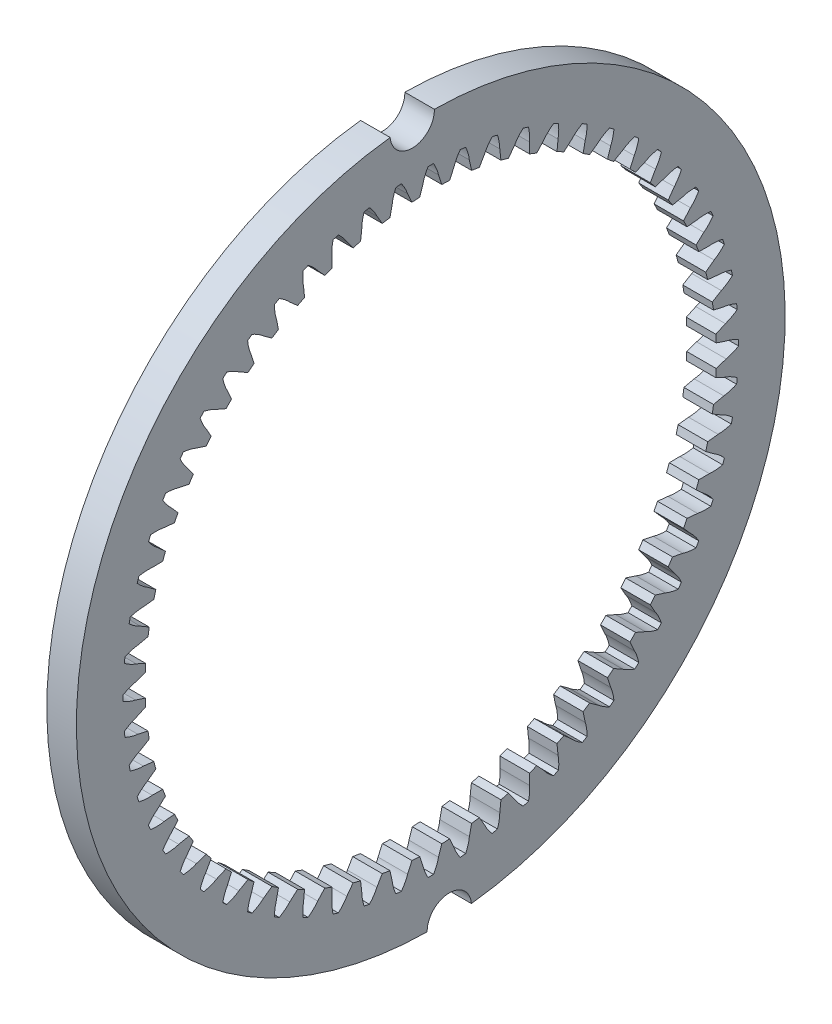
from build123d import *

# Parameters (mm, degrees)
SKETCH1_R           = 38.0746
BOSS_EXTRUDE1_DEPTH = 3.175
SKETCH2_R           = 2.38125
CUT_EXTRUDE1_DEPTH  = 54.939141365


with BuildPart() as part:
    # Sketch1 → Boss-Extrude1 (new body)
    with BuildSketch(Plane(origin=(1.5875, 0, 0), x_dir=(0, 0, -1), z_dir=(1, 0, 0))):
        Circle(SKETCH1_R)
        with BuildLine():
            Line((4.144197824, 31.478375504), (4.388639046, 30.376277753))
            ThreePointArc((4.388639046, 30.376277753), (4.801234456, 30.31380132), (5.212942289, 30.245720945))
            Line((5.212942289, 30.245720945), (5.785986641, 31.218341701))
            add(Edge.make_bspline(
                [(5.785986641, 31.218341701), (5.844202002, 31.356021898), (5.913994115, 31.489020631), (5.990529174, 31.617423316), (6.07466852, 31.758583698), (6.167718975, 31.894650011), (6.26694658, 32.025644535), (6.367255107, 32.158066029), (6.474210908, 32.285634892), (6.586210774, 32.408326712)],
                knots=[0, 0, 0, 0, 0.000448446, 0.000448446, 0.000448446, 0.000941262, 0.000941262, 0.000941262, 0.001439296, 0.001439296, 0.001439296, 0.001439296], degree=3))
            ThreePointArc((6.586210774, 32.408326712), (6.875805945, 32.348123674), (7.164851079, 32.285332918))
            add(Edge.make_bspline(
                [(7.164851079, 32.285332918), (7.208472411, 32.148164431), (7.247474787, 32.009413598), (7.281008539, 31.869436807), (7.314548979, 31.729432099), (7.342732666, 31.587992829), (7.36442758, 31.445670624), (7.39330493, 31.256230451), (7.410959621, 31.064373318), (7.411881692, 30.87274704)],
                knots=[0, 0, 0, 0, 0.000431813, 0.000431813, 0.000431813, 0.000863771, 0.000863771, 0.000863771, 0.001439558, 0.001439558, 0.001439558, 0.001439558], degree=3))
            Line((7.411881692, 30.87274704), (7.539783255, 29.751135629))
            ThreePointArc((7.539783255, 29.751135629), (7.943587859, 29.645873485), (8.345923977, 29.535130874))
            Line((8.345923977, 29.535130874), (9.017495684, 30.442524067))
            add(Edge.make_bspline(
                [(9.017495684, 30.442524067), (9.089783635, 30.573364875), (9.173095574, 30.698339765), (9.262633101, 30.818038955), (9.3610668, 30.949631088), (9.467830317, 31.075225596), (9.580206999, 31.195130408), (9.693807841, 31.316341387), (9.813512304, 31.432031489), (9.93772341, 31.542344017)],
                knots=[0, 0, 0, 0, 0.000448446, 0.000448446, 0.000448446, 0.000941262, 0.000941262, 0.000941262, 0.001439296, 0.001439296, 0.001439296, 0.001439296], degree=3))
            ThreePointArc((9.93772341, 31.542344017), (10.219439218, 31.452199839), (10.500337511, 31.359539614))
            add(Edge.make_bspline(
                [(10.500337511, 31.359539614), (10.52938187, 31.218562878), (10.553667176, 31.076495278), (10.572385668, 30.933780062), (10.591107892, 30.791036384), (10.604352756, 30.647425936), (10.611052102, 30.503615651), (10.619969369, 30.312194746), (10.617472814, 30.119543209), (10.598359434, 29.928870298)],
                knots=[0, 0, 0, 0, 0.000431813, 0.000431813, 0.000431813, 0.000863771, 0.000863771, 0.000863771, 0.001439558, 0.001439558, 0.001439558, 0.001439558], degree=3))
            Line((10.598359434, 29.928870298), (10.608320021, 28.800033839))
            ThreePointArc((10.608320021, 28.800033839), (10.998909651, 28.653139257), (11.387465975, 28.500947729))
            Line((11.387465975, 28.500947729), (12.150207158, 29.333171769))
            add(Edge.make_bspline(
                [(12.150207158, 29.333171769), (12.235775697, 29.455739668), (12.331694676, 29.571321463), (12.433253679, 29.681005709), (12.544903273, 29.801587843), (12.664210129, 29.915334504), (12.788504666, 30.022835904), (12.914153188, 30.131508355), (13.045294806, 30.234052171), (13.18035627, 30.330776799)],
                knots=[0, 0, 0, 0, 0.000448446, 0.000448446, 0.000448446, 0.000941262, 0.000941262, 0.000941262, 0.001439296, 0.001439296, 0.001439296, 0.001439296], degree=3))
            ThreePointArc((13.18035627, 30.330776799), (13.451106176, 30.211679121), (13.720780048, 30.090164631))
            add(Edge.make_bspline(
                [(13.720780048, 30.090164631), (13.734929217, 29.946924218), (13.744231378, 29.803096374), (13.747929526, 29.659206352), (13.751628411, 29.515287633), (13.749789339, 29.371079433), (13.741419716, 29.227356683), (13.7302792, 29.036052294), (13.707658753, 28.844717083), (13.668719331, 28.65708659)],
                knots=[0, 0, 0, 0, 0.000431813, 0.000431813, 0.000431813, 0.000863771, 0.000863771, 0.000863771, 0.001439558, 0.001439558, 0.001439558, 0.001439558], degree=3))
            Line((13.668719331, 28.65708659), (13.560629814, 27.53339285))
            ThreePointArc((13.560629814, 27.53339285), (13.933725088, 27.346475238), (14.304244512, 27.154502236))
            Line((14.304244512, 27.154502236), (15.14979842, 27.902439102))
            add(Edge.make_bspline(
                [(15.14979842, 27.902439102), (15.24771004, 28.015391215), (15.355185153, 28.120313578), (15.467652932, 28.218781155), (15.591295162, 28.327032167), (15.721838206, 28.427684749), (15.8566888, 28.521604928), (15.99300837, 28.616548213), (16.134150328, 28.704822251), (16.278582387, 28.786899244)],
                knots=[0, 0, 0, 0, 0.000448446, 0.000448446, 0.000448446, 0.000941262, 0.000941262, 0.000941262, 0.001439296, 0.001439296, 0.001439296, 0.001439296], degree=3))
            ThreePointArc((16.278582387, 28.786899244), (16.5354, 28.640152923), (16.790894848, 28.491115507))
            add(Edge.make_bspline(
                [(16.790894848, 28.491115507), (16.789993806, 28.34718079), (16.784210905, 28.203168509), (16.772848191, 28.05968017), (16.761483211, 27.916163215), (16.744580352, 27.772937237), (16.721233461, 27.63087668), (16.69015722, 27.441784776), (16.647660715, 27.253862201), (16.58932188, 27.071329845)],
                knots=[0, 0, 0, 0, 0.000431813, 0.000431813, 0.000431813, 0.000863771, 0.000863771, 0.000863771, 0.001439558, 0.001439558, 0.001439558, 0.001439558], degree=3))
            Line((16.58932188, 27.071329845), (16.364366508, 25.965090248))
            ThreePointArc((16.364366508, 25.965090248), (16.715879716, 25.740197515), (17.064302754, 25.510546335))
            Line((17.064302754, 25.510546335), (17.98340532, 26.166001473))
            add(Edge.make_bspline(
                [(17.98340532, 26.166001473), (18.09258728, 26.268100271), (18.210441006, 26.36121365), (18.332585338, 26.447385727), (18.466865556, 26.542119597), (18.607214531, 26.62857533), (18.751143732, 26.707885279), (18.896640805, 26.788059179), (19.046236722, 26.861096291), (19.19845695, 26.927626397)],
                knots=[0, 0, 0, 0, 0.000448446, 0.000448446, 0.000448446, 0.000941262, 0.000941262, 0.000941262, 0.001439296, 0.001439296, 0.001439296, 0.001439296], degree=3))
            ThreePointArc((19.19845695, 26.927626397), (19.438528522, 26.754839218), (19.67704509, 26.57991176))
            add(Edge.make_bspline(
                [(19.67704509, 26.57991176), (19.661103709, 26.436859717), (19.640299105, 26.294240828), (19.614000022, 26.152726261), (19.587695693, 26.01118347), (19.555914239, 25.870508929), (19.517845872, 25.731667009), (19.467174385, 25.546859323), (19.405267421, 25.364408301), (19.328168346, 25.188973945)],
                knots=[0, 0, 0, 0, 0.000431813, 0.000431813, 0.000431813, 0.000863771, 0.000863771, 0.000863771, 0.001439558, 0.001439558, 0.001439558, 0.001439558], degree=3))
            Line((19.328168346, 25.188973945), (18.988811778, 24.112308683))
            ThreePointArc((18.988811778, 24.112308683), (19.314891669, 23.8519048), (19.637400923, 23.587091549))
            Line((19.637400923, 23.587091549), (20.619982268, 24.142883657))
            add(Edge.make_bspline(
                [(20.619982268, 24.142883657), (20.739238348, 24.233010524), (20.866179458, 24.313294749), (20.996662106, 24.386227208), (21.140109108, 24.466406011), (21.288726322, 24.537717668), (21.44015721, 24.60154845), (21.59323769, 24.666074564), (21.749648562, 24.72307454), (21.907989201, 24.77332884)],
                knots=[0, 0, 0, 0, 0.000448446, 0.000448446, 0.000448446, 0.000941262, 0.000941262, 0.000941262, 0.001439296, 0.001439296, 0.001439296, 0.001439296], degree=3))
            ThreePointArc((21.907989201, 24.77332884), (22.128684457, 24.576393894), (22.347609508, 24.377492937))
            add(Edge.make_bspline(
                [(22.347609508, 24.377492937), (22.316802446, 24.236890876), (22.281204078, 24.097227942), (22.240256764, 23.959237609), (22.199301283, 23.821219755), (22.152989436, 23.684637911), (22.10061668, 23.55053581), (22.030905113, 23.372037132), (21.950265958, 23.197056635), (21.855251355, 23.030642375)],
                knots=[0, 0, 0, 0, 0.000431813, 0.000431813, 0.000431813, 0.000863771, 0.000863771, 0.000863771, 0.001439558, 0.001439558, 0.001439558, 0.001439558], degree=3))
            Line((21.855251355, 23.030642375), (21.405211653, 21.995347619))
            ThreePointArc((21.405211653, 21.995347619), (21.702285626, 21.702285626), (21.995347619, 21.405211653))
            Line((21.995347619, 21.405211653), (23.030642375, 21.855251355))
            add(Edge.make_bspline(
                [(23.030642375, 21.855251355), (23.158665981, 21.932418843), (23.293303681, 21.998994304), (23.430695049, 22.05788808), (23.5817372, 22.12263336), (23.736994371, 22.178019635), (23.894267839, 22.225671908), (24.053254543, 22.273843274), (24.2147667, 22.31418161), (24.377492937, 22.347609508)],
                knots=[0, 0, 0, 0, 0.000448446, 0.000448446, 0.000448446, 0.000941262, 0.000941262, 0.000941262, 0.001439296, 0.001439296, 0.001439296, 0.001439296], degree=3))
            ThreePointArc((24.377492937, 22.347609508), (24.576393894, 22.128684457), (24.77332884, 21.907989201))
            add(Edge.make_bspline(
                [(24.77332884, 21.907989201), (24.727993625, 21.771377588), (24.677991516, 21.636200784), (24.622844598, 21.503246536), (24.567686682, 21.370265772), (24.507351846, 21.239273044), (24.441248507, 21.111380011), (24.353260634, 20.941146011), (24.254772786, 20.775553163), (24.142883657, 20.619982268)],
                knots=[0, 0, 0, 0, 0.000431813, 0.000431813, 0.000431813, 0.000863771, 0.000863771, 0.000863771, 0.001439558, 0.001439558, 0.001439558, 0.001439558], degree=3))
            Line((24.142883657, 20.619982268), (23.587091549, 19.637400923))
            ThreePointArc((23.587091549, 19.637400923), (23.8519048, 19.314891669), (24.112308683, 18.988811778))
            Line((24.112308683, 18.988811778), (25.188973945, 19.328168346))
            add(Edge.make_bspline(
                [(25.188973945, 19.328168346), (25.324362423, 19.391530992), (25.465221594, 19.443668273), (25.608016393, 19.487878114), (25.764998845, 19.536480509), (25.925194943, 19.575334579), (26.086587869, 19.606286254), (26.249738907, 19.637575096), (26.414582787, 19.660809837), (26.57991176, 19.67704509)],
                knots=[0, 0, 0, 0, 0.000448446, 0.000448446, 0.000448446, 0.000941262, 0.000941262, 0.000941262, 0.001439296, 0.001439296, 0.001439296, 0.001439296], degree=3))
            ThreePointArc((26.57991176, 19.67704509), (26.754839218, 19.438528522), (26.927626397, 19.19845695))
            add(Edge.make_bspline(
                [(26.927626397, 19.19845695), (26.868259731, 19.06733253), (26.804401716, 18.938122883), (26.735659395, 18.811661395), (26.666903365, 18.685174686), (26.593206581, 18.561206258), (26.514096901, 18.440923517), (26.408796736, 18.280819313), (26.293539249, 18.126428383), (26.166001473, 17.98340532)],
                knots=[0, 0, 0, 0, 0.000431813, 0.000431813, 0.000431813, 0.000863771, 0.000863771, 0.000863771, 0.001439558, 0.001439558, 0.001439558, 0.001439558], degree=3))
            Line((26.166001473, 17.98340532), (25.510546335, 17.064302754))
            ThreePointArc((25.510546335, 17.064302754), (25.740197515, 16.715879716), (25.965090248, 16.364366508))
            Line((25.965090248, 16.364366508), (27.071329845, 16.58932188))
            add(Edge.make_bspline(
                [(27.071329845, 16.58932188), (27.212599851, 16.638185469), (27.358137211, 16.675313344), (27.504770953, 16.704354878), (27.665973772, 16.73628189), (27.829353655, 16.758178061), (27.993097785, 16.772090024), (28.158625638, 16.786153536), (28.324995178, 16.792030117), (28.491115507, 16.790894848)],
                knots=[0, 0, 0, 0, 0.000448446, 0.000448446, 0.000448446, 0.000941262, 0.000941262, 0.000941262, 0.001439296, 0.001439296, 0.001439296, 0.001439296], degree=3))
            ThreePointArc((28.491115507, 16.790894848), (28.640152923, 16.5354), (28.786899244, 16.278582387))
            add(Edge.make_bspline(
                [(28.786899244, 16.278582387), (28.714151561, 16.154381787), (28.637137281, 16.032554944), (28.555552713, 15.913971754), (28.473951873, 15.795364915), (28.387700579, 15.67977901), (28.2964513, 15.568424404), (28.174992534, 15.420204132), (28.044228193, 15.27870666), (27.902439102, 15.14979842)],
                knots=[0, 0, 0, 0, 0.000431813, 0.000431813, 0.000431813, 0.000863771, 0.000863771, 0.000863771, 0.001439558, 0.001439558, 0.001439558, 0.001439558], degree=3))
            Line((27.902439102, 15.14979842), (27.154502236, 14.304244512))
            ThreePointArc((27.154502236, 14.304244512), (27.346475238, 13.933725088), (27.53339285, 13.560629814))
            Line((27.53339285, 13.560629814), (28.65708659, 13.668719331))
            add(Edge.make_bspline(
                [(28.65708659, 13.668719331), (28.80269034, 13.702548504), (28.95131135, 13.724260192), (29.100177484, 13.737815234), (29.263834498, 13.752717063), (29.428608143, 13.757415437), (29.592909461, 13.754135267), (29.759000573, 13.750819365), (29.925072994, 13.739273401), (30.090164631, 13.720780048)],
                knots=[0, 0, 0, 0, 0.000448446, 0.000448446, 0.000448446, 0.000941262, 0.000941262, 0.000941262, 0.001439296, 0.001439296, 0.001439296, 0.001439296], degree=3))
            ThreePointArc((30.090164631, 13.720780048), (30.211679121, 13.451106176), (30.330776799, 13.18035627))
            add(Edge.make_bspline(
                [(30.330776799, 13.18035627), (30.245445137, 13.064440256), (30.156118377, 12.951330978), (30.062585418, 12.841925308), (29.969033806, 12.73249782), (29.871172989, 12.626560821), (29.768783856, 12.525354374), (29.632497218, 12.390641967), (29.487658704, 12.263588229), (29.333171769, 12.150207158)],
                knots=[0, 0, 0, 0, 0.000431813, 0.000431813, 0.000431813, 0.000863771, 0.000863771, 0.000863771, 0.001439558, 0.001439558, 0.001439558, 0.001439558], degree=3))
            Line((29.333171769, 12.150207158), (28.500947729, 11.387465975))
            ThreePointArc((28.500947729, 11.387465975), (28.653139257, 10.998909651), (28.800033839, 10.608320021))
            Line((28.800033839, 10.608320021), (29.928870298, 10.598359434))
            add(Edge.make_bspline(
                [(29.928870298, 10.598359434), (30.077212527, 10.61678355), (30.227288865, 10.622841174), (30.376756382, 10.620761212), (30.541074531, 10.618474591), (30.705436642, 10.60592369), (30.86849503, 10.585487325), (31.033329671, 10.564828339), (31.197285448, 10.53598633), (31.359539614, 10.500337511)],
                knots=[0, 0, 0, 0, 0.000448446, 0.000448446, 0.000448446, 0.000941262, 0.000941262, 0.000941262, 0.001439296, 0.001439296, 0.001439296, 0.001439296], degree=3))
            ThreePointArc((31.359539614, 10.500337511), (31.452199839, 10.219439218), (31.542344017, 9.93772341))
            add(Edge.make_bspline(
                [(31.542344017, 9.93772341), (31.445363288, 9.831361985), (31.344702729, 9.728209519), (31.240246148, 9.629180043), (31.135768734, 9.530130816), (31.027370577, 9.435003392), (30.914963389, 9.345053943), (30.765342061, 9.225325338), (30.608016256, 9.11410736), (30.442524067, 9.017495684)],
                knots=[0, 0, 0, 0, 0.000431813, 0.000431813, 0.000431813, 0.000863771, 0.000863771, 0.000863771, 0.001439558, 0.001439558, 0.001439558, 0.001439558], degree=3))
            Line((30.442524067, 9.017495684), (29.535130874, 8.345923977))
            ThreePointArc((29.535130874, 8.345923977), (29.645873485, 7.943587859), (29.751135629, 7.539783255))
            Line((29.751135629, 7.539783255), (30.87274704, 7.411881692))
            add(Edge.make_bspline(
                [(30.87274704, 7.411881692), (31.022202479, 7.414698894), (31.172089878, 7.405036085), (31.320521181, 7.387343907), (31.483700161, 7.367893888), (31.645849953, 7.338231224), (31.805878908, 7.300862569), (31.967651115, 7.263086843), (32.127693914, 7.217264789), (32.285332918, 7.164851079)],
                knots=[0, 0, 0, 0, 0.000448446, 0.000448446, 0.000448446, 0.000941262, 0.000941262, 0.000941262, 0.001439296, 0.001439296, 0.001439296, 0.001439296], degree=3))
            ThreePointArc((32.285332918, 7.164851079), (32.348123674, 6.875805945), (32.408326712, 6.586210774))
            add(Edge.make_bspline(
                [(32.408326712, 6.586210774), (32.300759457, 6.490569254), (32.18986796, 6.398503762), (32.075632204, 6.310935465), (31.961373665, 6.223349704), (31.843625801, 6.140074091), (31.722432114, 6.062367146), (31.56111538, 5.958934113), (31.393025978, 5.864770424), (31.218341701, 5.785986641)],
                knots=[0, 0, 0, 0, 0.000431813, 0.000431813, 0.000431813, 0.000863771, 0.000863771, 0.000863771, 0.001439558, 0.001439558, 0.001439558, 0.001439558], degree=3))
            Line((31.218341701, 5.785986641), (30.245720945, 5.212942289))
            ThreePointArc((30.245720945, 5.212942289), (30.31380132, 4.801234456), (30.376277753, 4.388639046))
            Line((30.376277753, 4.388639046), (31.478375504, 4.144197824))
            add(Edge.make_bspline(
                [(31.478375504, 4.144197824), (31.627306689, 4.131377246), (31.77536295, 4.10609987), (31.921131795, 4.072989316), (32.081383783, 4.036588999), (32.239544709, 3.990139561), (32.39479092, 3.936248035), (32.551728284, 3.881769448), (32.706104643, 3.819469384), (32.857401359, 3.750865039)],
                knots=[0, 0, 0, 0, 0.000448446, 0.000448446, 0.000448446, 0.000941262, 0.000941262, 0.000941262, 0.001439296, 0.001439296, 0.001439296, 0.001439296], degree=3))
            ThreePointArc((32.857401359, 3.750865039), (32.889634697, 3.456839903), (32.919236998, 3.162538234))
            add(Edge.make_bspline(
                [(32.919236998, 3.162538234), (32.802261748, 3.078664488), (32.682354261, 2.998694659), (32.559590921, 2.923546958), (32.436803098, 2.84838427), (32.310995597, 2.777872854), (32.182343234, 2.713259785), (32.011098514, 2.627255559), (31.834087137, 2.551177835), (31.652124651, 2.491085117)],
                knots=[0, 0, 0, 0, 0.000431813, 0.000431813, 0.000431813, 0.000863771, 0.000863771, 0.000863771, 0.001439558, 0.001439558, 0.001439558, 0.001439558], degree=3))
            Line((31.652124651, 2.491085117), (30.624932567, 2.022846515))
            ThreePointArc((30.624932567, 2.022846515), (30.649604804, 1.606277724), (30.66861102, 1.189411989))
            Line((30.66861102, 1.189411989), (31.7391203, 0.831109257))
            add(Edge.make_bspline(
                [(31.7391203, 0.831109257), (31.885895508, 0.802791364), (32.030498496, 0.762176367), (32.172007808, 0.714010203), (32.32757705, 0.661058396), (32.480016265, 0.598331095), (32.628778823, 0.528507144), (32.779161905, 0.457922575), (32.926180444, 0.379827073), (33.069477235, 0.295783737)],
                knots=[0, 0, 0, 0, 0.000448446, 0.000448446, 0.000448446, 0.000941262, 0.000941262, 0.000941262, 0.001439296, 0.001439296, 0.001439296, 0.001439296], degree=3))
            ThreePointArc((33.069477235, 0.295783737), (33.0708, 0), (33.069477235, -0.295783737))
            add(Edge.make_bspline(
                [(33.069477235, -0.295783737), (32.944375593, -0.36697077), (32.816765849, -0.433968771), (32.686819946, -0.495872542), (32.556848127, -0.557788658), (32.424359363, -0.614763341), (32.289657866, -0.665574619), (32.110361353, -0.733207757), (31.926367375, -0.790365992), (31.7391203, -0.831109257)],
                knots=[0, 0, 0, 0, 0.000431813, 0.000431813, 0.000431813, 0.000863771, 0.000863771, 0.000863771, 0.001439558, 0.001439558, 0.001439558, 0.001439558], degree=3))
            Line((31.7391203, -0.831109257), (30.66861102, -1.189411989))
            ThreePointArc((30.66861102, -1.189411989), (30.649604804, -1.606277724), (30.624932567, -2.022846515))
            Line((30.624932567, -2.022846515), (31.652124651, -2.491085117))
            add(Edge.make_bspline(
                [(31.652124651, -2.491085117), (31.795135784, -2.534590069), (31.9347012, -2.590097701), (32.070400574, -2.652791758), (32.21958262, -2.721714902), (32.364629969, -2.800032813), (32.505279, -2.885024183), (32.647460171, -2.970941394), (32.785510123, -3.063976702), (32.919236998, -3.162538234)],
                knots=[0, 0, 0, 0, 0.000448446, 0.000448446, 0.000448446, 0.000941262, 0.000941262, 0.000941262, 0.001439296, 0.001439296, 0.001439296, 0.001439296], degree=3))
            ThreePointArc((32.919236998, -3.162538234), (32.889634697, -3.456839903), (32.857401359, -3.750865039))
            add(Edge.make_bspline(
                [(32.857401359, -3.750865039), (32.725543966, -3.80858542), (32.591630084, -3.861877548), (32.455925332, -3.909859158), (32.320193516, -3.957850337), (32.182475063, -4.000664059), (32.043200251, -4.037116847), (31.857816354, -4.085637895), (31.668855652, -4.123250404), (31.478375504, -4.144197824)],
                knots=[0, 0, 0, 0, 0.000431813, 0.000431813, 0.000431813, 0.000863771, 0.000863771, 0.000863771, 0.001439558, 0.001439558, 0.001439558, 0.001439558], degree=3))
            Line((31.478375504, -4.144197824), (30.376277753, -4.388639046))
            ThreePointArc((30.376277753, -4.388639046), (30.31380132, -4.801234456), (30.245720945, -5.212942289))
            Line((30.245720945, -5.212942289), (31.218341701, -5.785986641))
            add(Edge.make_bspline(
                [(31.218341701, -5.785986641), (31.356021898, -5.844202002), (31.489020631, -5.913994115), (31.617423316, -5.990529174), (31.758583698, -6.07466852), (31.894650011, -6.167718975), (32.025644535, -6.26694658), (32.158066029, -6.367255107), (32.285634892, -6.474210908), (32.408326712, -6.586210774)],
                knots=[0, 0, 0, 0, 0.000448446, 0.000448446, 0.000448446, 0.000941262, 0.000941262, 0.000941262, 0.001439296, 0.001439296, 0.001439296, 0.001439296], degree=3))
            ThreePointArc((32.408326712, -6.586210774), (32.348123674, -6.875805945), (32.285332918, -7.164851079))
            add(Edge.make_bspline(
                [(32.285332918, -7.164851079), (32.148164431, -7.208472411), (32.009413598, -7.247474787), (31.869436807, -7.281008539), (31.729432099, -7.314548979), (31.587992829, -7.342732666), (31.445670624, -7.36442758), (31.256230451, -7.39330493), (31.064373318, -7.410959621), (30.87274704, -7.411881692)],
                knots=[0, 0, 0, 0, 0.000431813, 0.000431813, 0.000431813, 0.000863771, 0.000863771, 0.000863771, 0.001439558, 0.001439558, 0.001439558, 0.001439558], degree=3))
            Line((30.87274704, -7.411881692), (29.751135629, -7.539783255))
            ThreePointArc((29.751135629, -7.539783255), (29.645873485, -7.943587859), (29.535130874, -8.345923977))
            Line((29.535130874, -8.345923977), (30.442524067, -9.017495684))
            add(Edge.make_bspline(
                [(30.442524067, -9.017495684), (30.573364875, -9.089783635), (30.698339765, -9.173095574), (30.818038955, -9.262633101), (30.949631088, -9.3610668), (31.075225596, -9.467830317), (31.195130408, -9.580206999), (31.316341387, -9.693807841), (31.432031489, -9.813512304), (31.542344017, -9.93772341)],
                knots=[0, 0, 0, 0, 0.000448446, 0.000448446, 0.000448446, 0.000941262, 0.000941262, 0.000941262, 0.001439296, 0.001439296, 0.001439296, 0.001439296], degree=3))
            ThreePointArc((31.542344017, -9.93772341), (31.452199839, -10.219439218), (31.359539614, -10.500337511))
            add(Edge.make_bspline(
                [(31.359539614, -10.500337511), (31.218562878, -10.52938187), (31.076495278, -10.553667176), (30.933780062, -10.572385668), (30.791036384, -10.591107892), (30.647425936, -10.604352756), (30.503615651, -10.611052102), (30.312194746, -10.619969369), (30.119543209, -10.617472814), (29.928870298, -10.598359434)],
                knots=[0, 0, 0, 0, 0.000431813, 0.000431813, 0.000431813, 0.000863771, 0.000863771, 0.000863771, 0.001439558, 0.001439558, 0.001439558, 0.001439558], degree=3))
            Line((29.928870298, -10.598359434), (28.800033839, -10.608320021))
            ThreePointArc((28.800033839, -10.608320021), (28.653139257, -10.998909651), (28.500947729, -11.387465975))
            Line((28.500947729, -11.387465975), (29.333171769, -12.150207158))
            add(Edge.make_bspline(
                [(29.333171769, -12.150207158), (29.455739668, -12.235775697), (29.571321463, -12.331694676), (29.681005709, -12.433253679), (29.801587843, -12.544903273), (29.915334504, -12.664210129), (30.022835904, -12.788504666), (30.131508355, -12.914153188), (30.234052171, -13.045294806), (30.330776799, -13.18035627)],
                knots=[0, 0, 0, 0, 0.000448446, 0.000448446, 0.000448446, 0.000941262, 0.000941262, 0.000941262, 0.001439296, 0.001439296, 0.001439296, 0.001439296], degree=3))
            ThreePointArc((30.330776799, -13.18035627), (30.211679121, -13.451106176), (30.090164631, -13.720780048))
            add(Edge.make_bspline(
                [(30.090164631, -13.720780048), (29.946924218, -13.734929217), (29.803096374, -13.744231378), (29.659206352, -13.747929526), (29.515287633, -13.751628411), (29.371079433, -13.749789339), (29.227356683, -13.741419716), (29.036052294, -13.7302792), (28.844717083, -13.707658753), (28.65708659, -13.668719331)],
                knots=[0, 0, 0, 0, 0.000431813, 0.000431813, 0.000431813, 0.000863771, 0.000863771, 0.000863771, 0.001439558, 0.001439558, 0.001439558, 0.001439558], degree=3))
            Line((28.65708659, -13.668719331), (27.53339285, -13.560629814))
            ThreePointArc((27.53339285, -13.560629814), (27.346475238, -13.933725088), (27.154502236, -14.304244512))
            Line((27.154502236, -14.304244512), (27.902439102, -15.14979842))
            add(Edge.make_bspline(
                [(27.902439102, -15.14979842), (28.015391215, -15.24771004), (28.120313578, -15.355185153), (28.218781155, -15.467652932), (28.327032167, -15.591295162), (28.427684749, -15.721838206), (28.521604928, -15.8566888), (28.616548213, -15.99300837), (28.704822251, -16.134150328), (28.786899244, -16.278582387)],
                knots=[0, 0, 0, 0, 0.000448446, 0.000448446, 0.000448446, 0.000941262, 0.000941262, 0.000941262, 0.001439296, 0.001439296, 0.001439296, 0.001439296], degree=3))
            ThreePointArc((28.786899244, -16.278582387), (28.640152923, -16.5354), (28.491115507, -16.790894848))
            add(Edge.make_bspline(
                [(28.491115507, -16.790894848), (28.34718079, -16.789993806), (28.203168509, -16.784210905), (28.05968017, -16.772848191), (27.916163215, -16.761483211), (27.772937237, -16.744580352), (27.63087668, -16.721233461), (27.441784776, -16.69015722), (27.253862201, -16.647660715), (27.071329845, -16.58932188)],
                knots=[0, 0, 0, 0, 0.000431813, 0.000431813, 0.000431813, 0.000863771, 0.000863771, 0.000863771, 0.001439558, 0.001439558, 0.001439558, 0.001439558], degree=3))
            Line((27.071329845, -16.58932188), (25.965090248, -16.364366508))
            ThreePointArc((25.965090248, -16.364366508), (25.740197515, -16.715879716), (25.510546335, -17.064302754))
            Line((25.510546335, -17.064302754), (26.166001473, -17.98340532))
            add(Edge.make_bspline(
                [(26.166001473, -17.98340532), (26.268100271, -18.09258728), (26.36121365, -18.210441006), (26.447385727, -18.332585338), (26.542119597, -18.466865556), (26.62857533, -18.607214531), (26.707885279, -18.751143732), (26.788059179, -18.896640805), (26.861096291, -19.046236722), (26.927626397, -19.19845695)],
                knots=[0, 0, 0, 0, 0.000448446, 0.000448446, 0.000448446, 0.000941262, 0.000941262, 0.000941262, 0.001439296, 0.001439296, 0.001439296, 0.001439296], degree=3))
            ThreePointArc((26.927626397, -19.19845695), (26.754839218, -19.438528522), (26.57991176, -19.67704509))
            add(Edge.make_bspline(
                [(26.57991176, -19.67704509), (26.436859717, -19.661103709), (26.294240828, -19.640299105), (26.152726261, -19.614000022), (26.01118347, -19.587695693), (25.870508929, -19.555914239), (25.731667009, -19.517845872), (25.546859323, -19.467174385), (25.364408301, -19.405267421), (25.188973945, -19.328168346)],
                knots=[0, 0, 0, 0, 0.000431813, 0.000431813, 0.000431813, 0.000863771, 0.000863771, 0.000863771, 0.001439558, 0.001439558, 0.001439558, 0.001439558], degree=3))
            Line((25.188973945, -19.328168346), (24.112308683, -18.988811778))
            ThreePointArc((24.112308683, -18.988811778), (23.8519048, -19.314891669), (23.587091549, -19.637400923))
            Line((23.587091549, -19.637400923), (24.142883657, -20.619982268))
            add(Edge.make_bspline(
                [(24.142883657, -20.619982268), (24.233010524, -20.739238348), (24.313294749, -20.866179458), (24.386227208, -20.996662106), (24.466406011, -21.140109108), (24.537717668, -21.288726322), (24.60154845, -21.44015721), (24.666074564, -21.59323769), (24.72307454, -21.749648562), (24.77332884, -21.907989201)],
                knots=[0, 0, 0, 0, 0.000448446, 0.000448446, 0.000448446, 0.000941262, 0.000941262, 0.000941262, 0.001439296, 0.001439296, 0.001439296, 0.001439296], degree=3))
            ThreePointArc((24.77332884, -21.907989201), (24.576393894, -22.128684457), (24.377492937, -22.347609508))
            add(Edge.make_bspline(
                [(24.377492937, -22.347609508), (24.236890876, -22.316802446), (24.097227942, -22.281204078), (23.959237609, -22.240256764), (23.821219755, -22.199301283), (23.684637911, -22.152989436), (23.55053581, -22.10061668), (23.372037132, -22.030905113), (23.197056635, -21.950265958), (23.030642375, -21.855251355)],
                knots=[0, 0, 0, 0, 0.000431813, 0.000431813, 0.000431813, 0.000863771, 0.000863771, 0.000863771, 0.001439558, 0.001439558, 0.001439558, 0.001439558], degree=3))
            Line((23.030642375, -21.855251355), (21.995347619, -21.405211653))
            ThreePointArc((21.995347619, -21.405211653), (21.702285626, -21.702285626), (21.405211653, -21.995347619))
            Line((21.405211653, -21.995347619), (21.855251355, -23.030642375))
            add(Edge.make_bspline(
                [(21.855251355, -23.030642375), (21.932418843, -23.158665981), (21.998994304, -23.293303681), (22.05788808, -23.430695049), (22.12263336, -23.5817372), (22.178019635, -23.736994371), (22.225671908, -23.894267839), (22.273843274, -24.053254543), (22.31418161, -24.2147667), (22.347609508, -24.377492937)],
                knots=[0, 0, 0, 0, 0.000448446, 0.000448446, 0.000448446, 0.000941262, 0.000941262, 0.000941262, 0.001439296, 0.001439296, 0.001439296, 0.001439296], degree=3))
            ThreePointArc((22.347609508, -24.377492937), (22.128684457, -24.576393894), (21.907989201, -24.77332884))
            add(Edge.make_bspline(
                [(21.907989201, -24.77332884), (21.771377588, -24.727993625), (21.636200784, -24.677991516), (21.503246536, -24.622844598), (21.370265772, -24.567686682), (21.239273044, -24.507351846), (21.111380011, -24.441248507), (20.941146011, -24.353260634), (20.775553163, -24.254772786), (20.619982268, -24.142883657)],
                knots=[0, 0, 0, 0, 0.000431813, 0.000431813, 0.000431813, 0.000863771, 0.000863771, 0.000863771, 0.001439558, 0.001439558, 0.001439558, 0.001439558], degree=3))
            Line((20.619982268, -24.142883657), (19.637400923, -23.587091549))
            ThreePointArc((19.637400923, -23.587091549), (19.314891669, -23.8519048), (18.988811778, -24.112308683))
            Line((18.988811778, -24.112308683), (19.328168346, -25.188973945))
            add(Edge.make_bspline(
                [(19.328168346, -25.188973945), (19.391530992, -25.324362423), (19.443668273, -25.465221594), (19.487878114, -25.608016393), (19.536480509, -25.764998845), (19.575334579, -25.925194943), (19.606286254, -26.086587869), (19.637575096, -26.249738907), (19.660809837, -26.414582787), (19.67704509, -26.57991176)],
                knots=[0, 0, 0, 0, 0.000448446, 0.000448446, 0.000448446, 0.000941262, 0.000941262, 0.000941262, 0.001439296, 0.001439296, 0.001439296, 0.001439296], degree=3))
            ThreePointArc((19.67704509, -26.57991176), (19.438528522, -26.754839218), (19.19845695, -26.927626397))
            add(Edge.make_bspline(
                [(19.19845695, -26.927626397), (19.06733253, -26.868259731), (18.938122883, -26.804401716), (18.811661395, -26.735659395), (18.685174686, -26.666903365), (18.561206258, -26.593206581), (18.440923517, -26.514096901), (18.280819313, -26.408796736), (18.126428383, -26.293539249), (17.98340532, -26.166001473)],
                knots=[0, 0, 0, 0, 0.000431813, 0.000431813, 0.000431813, 0.000863771, 0.000863771, 0.000863771, 0.001439558, 0.001439558, 0.001439558, 0.001439558], degree=3))
            Line((17.98340532, -26.166001473), (17.064302754, -25.510546335))
            ThreePointArc((17.064302754, -25.510546335), (16.715879716, -25.740197515), (16.364366508, -25.965090248))
            Line((16.364366508, -25.965090248), (16.58932188, -27.071329845))
            add(Edge.make_bspline(
                [(16.58932188, -27.071329845), (16.638185469, -27.212599851), (16.675313344, -27.358137211), (16.704354878, -27.504770953), (16.73628189, -27.665973772), (16.758178061, -27.829353655), (16.772090024, -27.993097785), (16.786153536, -28.158625638), (16.792030117, -28.324995178), (16.790894848, -28.491115507)],
                knots=[0, 0, 0, 0, 0.000448446, 0.000448446, 0.000448446, 0.000941262, 0.000941262, 0.000941262, 0.001439296, 0.001439296, 0.001439296, 0.001439296], degree=3))
            ThreePointArc((16.790894848, -28.491115507), (16.5354, -28.640152923), (16.278582387, -28.786899244))
            add(Edge.make_bspline(
                [(16.278582387, -28.786899244), (16.154381787, -28.714151561), (16.032554944, -28.637137281), (15.913971754, -28.555552713), (15.795364915, -28.473951873), (15.67977901, -28.387700579), (15.568424404, -28.2964513), (15.420204132, -28.174992534), (15.27870666, -28.044228193), (15.14979842, -27.902439102)],
                knots=[0, 0, 0, 0, 0.000431813, 0.000431813, 0.000431813, 0.000863771, 0.000863771, 0.000863771, 0.001439558, 0.001439558, 0.001439558, 0.001439558], degree=3))
            Line((15.14979842, -27.902439102), (14.304244512, -27.154502236))
            ThreePointArc((14.304244512, -27.154502236), (13.933725088, -27.346475238), (13.560629814, -27.53339285))
            Line((13.560629814, -27.53339285), (13.668719331, -28.65708659))
            add(Edge.make_bspline(
                [(13.668719331, -28.65708659), (13.702548504, -28.80269034), (13.724260192, -28.95131135), (13.737815234, -29.100177484), (13.752717063, -29.263834498), (13.757415437, -29.428608143), (13.754135267, -29.592909461), (13.750819365, -29.759000573), (13.739273401, -29.925072994), (13.720780048, -30.090164631)],
                knots=[0, 0, 0, 0, 0.000448446, 0.000448446, 0.000448446, 0.000941262, 0.000941262, 0.000941262, 0.001439296, 0.001439296, 0.001439296, 0.001439296], degree=3))
            ThreePointArc((13.720780048, -30.090164631), (13.451106176, -30.211679121), (13.18035627, -30.330776799))
            add(Edge.make_bspline(
                [(13.18035627, -30.330776799), (13.064440256, -30.245445137), (12.951330978, -30.156118377), (12.841925308, -30.062585418), (12.73249782, -29.969033806), (12.626560821, -29.871172989), (12.525354374, -29.768783856), (12.390641967, -29.632497218), (12.263588229, -29.487658704), (12.150207158, -29.333171769)],
                knots=[0, 0, 0, 0, 0.000431813, 0.000431813, 0.000431813, 0.000863771, 0.000863771, 0.000863771, 0.001439558, 0.001439558, 0.001439558, 0.001439558], degree=3))
            Line((12.150207158, -29.333171769), (11.387465975, -28.500947729))
            ThreePointArc((11.387465975, -28.500947729), (10.998909651, -28.653139257), (10.608320021, -28.800033839))
            Line((10.608320021, -28.800033839), (10.598359434, -29.928870298))
            add(Edge.make_bspline(
                [(10.598359434, -29.928870298), (10.61678355, -30.077212527), (10.622841174, -30.227288865), (10.620761212, -30.376756382), (10.618474591, -30.541074531), (10.60592369, -30.705436642), (10.585487325, -30.86849503), (10.564828339, -31.033329671), (10.53598633, -31.197285448), (10.500337511, -31.359539614)],
                knots=[0, 0, 0, 0, 0.000448446, 0.000448446, 0.000448446, 0.000941262, 0.000941262, 0.000941262, 0.001439296, 0.001439296, 0.001439296, 0.001439296], degree=3))
            ThreePointArc((10.500337511, -31.359539614), (10.219439218, -31.452199839), (9.93772341, -31.542344017))
            add(Edge.make_bspline(
                [(9.93772341, -31.542344017), (9.831361985, -31.445363288), (9.728209519, -31.344702729), (9.629180043, -31.240246148), (9.530130816, -31.135768734), (9.435003392, -31.027370577), (9.345053943, -30.914963389), (9.225325338, -30.765342061), (9.11410736, -30.608016256), (9.017495684, -30.442524067)],
                knots=[0, 0, 0, 0, 0.000431813, 0.000431813, 0.000431813, 0.000863771, 0.000863771, 0.000863771, 0.001439558, 0.001439558, 0.001439558, 0.001439558], degree=3))
            Line((9.017495684, -30.442524067), (8.345923977, -29.535130874))
            ThreePointArc((8.345923977, -29.535130874), (7.943587859, -29.645873485), (7.539783255, -29.751135629))
            Line((7.539783255, -29.751135629), (7.411881692, -30.87274704))
            add(Edge.make_bspline(
                [(7.411881692, -30.87274704), (7.414698894, -31.022202479), (7.405036085, -31.172089878), (7.387343907, -31.320521181), (7.367893888, -31.483700161), (7.338231224, -31.645849953), (7.300862569, -31.805878908), (7.263086843, -31.967651115), (7.217264789, -32.127693914), (7.164851079, -32.285332918)],
                knots=[0, 0, 0, 0, 0.000448446, 0.000448446, 0.000448446, 0.000941262, 0.000941262, 0.000941262, 0.001439296, 0.001439296, 0.001439296, 0.001439296], degree=3))
            ThreePointArc((7.164851079, -32.285332918), (6.875805945, -32.348123674), (6.586210774, -32.408326712))
            add(Edge.make_bspline(
                [(6.586210774, -32.408326712), (6.490569254, -32.300759457), (6.398503762, -32.18986796), (6.310935465, -32.075632204), (6.223349704, -31.961373665), (6.140074091, -31.843625801), (6.062367146, -31.722432114), (5.958934113, -31.56111538), (5.864770424, -31.393025978), (5.785986641, -31.218341701)],
                knots=[0, 0, 0, 0, 0.000431813, 0.000431813, 0.000431813, 0.000863771, 0.000863771, 0.000863771, 0.001439558, 0.001439558, 0.001439558, 0.001439558], degree=3))
            Line((5.785986641, -31.218341701), (5.212942289, -30.245720945))
            ThreePointArc((5.212942289, -30.245720945), (4.801234456, -30.31380132), (4.388639046, -30.376277753))
            Line((4.388639046, -30.376277753), (4.144197824, -31.478375504))
            add(Edge.make_bspline(
                [(4.144197824, -31.478375504), (4.131377246, -31.627306689), (4.10609987, -31.77536295), (4.072989316, -31.921131795), (4.036588999, -32.081383783), (3.990139561, -32.239544709), (3.936248035, -32.39479092), (3.881769448, -32.551728284), (3.819469384, -32.706104643), (3.750865039, -32.857401359)],
                knots=[0, 0, 0, 0, 0.000448446, 0.000448446, 0.000448446, 0.000941262, 0.000941262, 0.000941262, 0.001439296, 0.001439296, 0.001439296, 0.001439296], degree=3))
            ThreePointArc((3.750865039, -32.857401359), (3.456839903, -32.889634697), (3.162538234, -32.919236998))
            add(Edge.make_bspline(
                [(3.162538234, -32.919236998), (3.078664488, -32.802261748), (2.998694659, -32.682354261), (2.923546958, -32.559590921), (2.84838427, -32.436803098), (2.777872854, -32.310995597), (2.713259785, -32.182343234), (2.627255559, -32.011098514), (2.551177835, -31.834087137), (2.491085117, -31.652124651)],
                knots=[0, 0, 0, 0, 0.000431813, 0.000431813, 0.000431813, 0.000863771, 0.000863771, 0.000863771, 0.001439558, 0.001439558, 0.001439558, 0.001439558], degree=3))
            Line((2.491085117, -31.652124651), (2.022846515, -30.624932567))
            ThreePointArc((2.022846515, -30.624932567), (1.606277724, -30.649604804), (1.189411989, -30.66861102))
            Line((1.189411989, -30.66861102), (0.831109257, -31.7391203))
            add(Edge.make_bspline(
                [(0.831109257, -31.7391203), (0.802791364, -31.885895508), (0.762176367, -32.030498496), (0.714010203, -32.172007808), (0.661058396, -32.32757705), (0.598331095, -32.480016265), (0.528507144, -32.628778823), (0.457922575, -32.779161905), (0.379827073, -32.926180444), (0.295783737, -33.069477235)],
                knots=[0, 0, 0, 0, 0.000448446, 0.000448446, 0.000448446, 0.000941262, 0.000941262, 0.000941262, 0.001439296, 0.001439296, 0.001439296, 0.001439296], degree=3))
            ThreePointArc((0.295783737, -33.069477235), (0, -33.0708), (-0.295783737, -33.069477235))
            add(Edge.make_bspline(
                [(-0.295783737, -33.069477235), (-0.36697077, -32.944375593), (-0.433968771, -32.816765849), (-0.495872542, -32.686819946), (-0.557788658, -32.556848127), (-0.614763341, -32.424359363), (-0.665574619, -32.289657866), (-0.733207757, -32.110361353), (-0.790365992, -31.926367375), (-0.831109257, -31.7391203)],
                knots=[0, 0, 0, 0, 0.000431813, 0.000431813, 0.000431813, 0.000863771, 0.000863771, 0.000863771, 0.001439558, 0.001439558, 0.001439558, 0.001439558], degree=3))
            Line((-0.831109257, -31.7391203), (-1.189411989, -30.66861102))
            ThreePointArc((-1.189411989, -30.66861102), (-1.606277724, -30.649604804), (-2.022846515, -30.624932567))
            Line((-2.022846515, -30.624932567), (-2.491085117, -31.652124651))
            add(Edge.make_bspline(
                [(-2.491085117, -31.652124651), (-2.534590069, -31.795135784), (-2.590097701, -31.9347012), (-2.652791758, -32.070400574), (-2.721714902, -32.21958262), (-2.800032813, -32.364629969), (-2.885024183, -32.505279), (-2.970941394, -32.647460171), (-3.063976702, -32.785510123), (-3.162538234, -32.919236998)],
                knots=[0, 0, 0, 0, 0.000448446, 0.000448446, 0.000448446, 0.000941262, 0.000941262, 0.000941262, 0.001439296, 0.001439296, 0.001439296, 0.001439296], degree=3))
            ThreePointArc((-3.162538234, -32.919236998), (-3.456839903, -32.889634697), (-3.750865039, -32.857401359))
            add(Edge.make_bspline(
                [(-3.750865039, -32.857401359), (-3.80858542, -32.725543966), (-3.861877548, -32.591630084), (-3.909859158, -32.455925332), (-3.957850337, -32.320193516), (-4.000664059, -32.182475063), (-4.037116847, -32.043200251), (-4.085637895, -31.857816354), (-4.123250404, -31.668855652), (-4.144197824, -31.478375504)],
                knots=[0, 0, 0, 0, 0.000431813, 0.000431813, 0.000431813, 0.000863771, 0.000863771, 0.000863771, 0.001439558, 0.001439558, 0.001439558, 0.001439558], degree=3))
            Line((-4.144197824, -31.478375504), (-4.388639046, -30.376277753))
            ThreePointArc((-4.388639046, -30.376277753), (-4.801234456, -30.31380132), (-5.212942289, -30.245720945))
            Line((-5.212942289, -30.245720945), (-5.785986641, -31.218341701))
            add(Edge.make_bspline(
                [(-5.785986641, -31.218341701), (-5.844202002, -31.356021898), (-5.913994115, -31.489020631), (-5.990529174, -31.617423316), (-6.07466852, -31.758583698), (-6.167718975, -31.894650011), (-6.26694658, -32.025644535), (-6.367255107, -32.158066029), (-6.474210908, -32.285634892), (-6.586210774, -32.408326712)],
                knots=[0, 0, 0, 0, 0.000448446, 0.000448446, 0.000448446, 0.000941262, 0.000941262, 0.000941262, 0.001439296, 0.001439296, 0.001439296, 0.001439296], degree=3))
            ThreePointArc((-6.586210774, -32.408326712), (-6.875805945, -32.348123674), (-7.164851079, -32.285332918))
            add(Edge.make_bspline(
                [(-7.164851079, -32.285332918), (-7.208472411, -32.148164431), (-7.247474787, -32.009413598), (-7.281008539, -31.869436807), (-7.314548979, -31.729432099), (-7.342732666, -31.587992829), (-7.36442758, -31.445670624), (-7.39330493, -31.256230451), (-7.410959621, -31.064373318), (-7.411881692, -30.87274704)],
                knots=[0, 0, 0, 0, 0.000431813, 0.000431813, 0.000431813, 0.000863771, 0.000863771, 0.000863771, 0.001439558, 0.001439558, 0.001439558, 0.001439558], degree=3))
            Line((-7.411881692, -30.87274704), (-7.539783255, -29.751135629))
            ThreePointArc((-7.539783255, -29.751135629), (-7.943587859, -29.645873485), (-8.345923977, -29.535130874))
            Line((-8.345923977, -29.535130874), (-9.017495684, -30.442524067))
            add(Edge.make_bspline(
                [(-9.017495684, -30.442524067), (-9.089783635, -30.573364875), (-9.173095574, -30.698339765), (-9.262633101, -30.818038955), (-9.3610668, -30.949631088), (-9.467830317, -31.075225596), (-9.580206999, -31.195130408), (-9.693807841, -31.316341387), (-9.813512304, -31.432031489), (-9.93772341, -31.542344017)],
                knots=[0, 0, 0, 0, 0.000448446, 0.000448446, 0.000448446, 0.000941262, 0.000941262, 0.000941262, 0.001439296, 0.001439296, 0.001439296, 0.001439296], degree=3))
            ThreePointArc((-9.93772341, -31.542344017), (-10.219439218, -31.452199839), (-10.500337511, -31.359539614))
            add(Edge.make_bspline(
                [(-10.500337511, -31.359539614), (-10.52938187, -31.218562878), (-10.553667176, -31.076495278), (-10.572385668, -30.933780062), (-10.591107892, -30.791036384), (-10.604352756, -30.647425936), (-10.611052102, -30.503615651), (-10.619969369, -30.312194746), (-10.617472814, -30.119543209), (-10.598359434, -29.928870298)],
                knots=[0, 0, 0, 0, 0.000431813, 0.000431813, 0.000431813, 0.000863771, 0.000863771, 0.000863771, 0.001439558, 0.001439558, 0.001439558, 0.001439558], degree=3))
            Line((-10.598359434, -29.928870298), (-10.608320021, -28.800033839))
            ThreePointArc((-10.608320021, -28.800033839), (-10.998909651, -28.653139257), (-11.387465975, -28.500947729))
            Line((-11.387465975, -28.500947729), (-12.150207158, -29.333171769))
            add(Edge.make_bspline(
                [(-12.150207158, -29.333171769), (-12.235775697, -29.455739668), (-12.331694676, -29.571321463), (-12.433253679, -29.681005709), (-12.544903273, -29.801587843), (-12.664210129, -29.915334504), (-12.788504666, -30.022835904), (-12.914153188, -30.131508355), (-13.045294806, -30.234052171), (-13.18035627, -30.330776799)],
                knots=[0, 0, 0, 0, 0.000448446, 0.000448446, 0.000448446, 0.000941262, 0.000941262, 0.000941262, 0.001439296, 0.001439296, 0.001439296, 0.001439296], degree=3))
            ThreePointArc((-13.18035627, -30.330776799), (-13.451106176, -30.211679121), (-13.720780048, -30.090164631))
            add(Edge.make_bspline(
                [(-13.720780048, -30.090164631), (-13.734929217, -29.946924218), (-13.744231378, -29.803096374), (-13.747929526, -29.659206352), (-13.751628411, -29.515287633), (-13.749789339, -29.371079433), (-13.741419716, -29.227356683), (-13.7302792, -29.036052294), (-13.707658753, -28.844717083), (-13.668719331, -28.65708659)],
                knots=[0, 0, 0, 0, 0.000431813, 0.000431813, 0.000431813, 0.000863771, 0.000863771, 0.000863771, 0.001439558, 0.001439558, 0.001439558, 0.001439558], degree=3))
            Line((-13.668719331, -28.65708659), (-13.560629814, -27.53339285))
            ThreePointArc((-13.560629814, -27.53339285), (-13.933725088, -27.346475238), (-14.304244512, -27.154502236))
            Line((-14.304244512, -27.154502236), (-15.14979842, -27.902439102))
            add(Edge.make_bspline(
                [(-15.14979842, -27.902439102), (-15.24771004, -28.015391215), (-15.355185153, -28.120313578), (-15.467652932, -28.218781155), (-15.591295162, -28.327032167), (-15.721838206, -28.427684749), (-15.8566888, -28.521604928), (-15.99300837, -28.616548213), (-16.134150328, -28.704822251), (-16.278582387, -28.786899244)],
                knots=[0, 0, 0, 0, 0.000448446, 0.000448446, 0.000448446, 0.000941262, 0.000941262, 0.000941262, 0.001439296, 0.001439296, 0.001439296, 0.001439296], degree=3))
            ThreePointArc((-16.278582387, -28.786899244), (-16.5354, -28.640152923), (-16.790894848, -28.491115507))
            add(Edge.make_bspline(
                [(-16.790894848, -28.491115507), (-16.789993806, -28.34718079), (-16.784210905, -28.203168509), (-16.772848191, -28.05968017), (-16.761483211, -27.916163215), (-16.744580352, -27.772937237), (-16.721233461, -27.63087668), (-16.69015722, -27.441784776), (-16.647660715, -27.253862201), (-16.58932188, -27.071329845)],
                knots=[0, 0, 0, 0, 0.000431813, 0.000431813, 0.000431813, 0.000863771, 0.000863771, 0.000863771, 0.001439558, 0.001439558, 0.001439558, 0.001439558], degree=3))
            Line((-16.58932188, -27.071329845), (-16.364366508, -25.965090248))
            ThreePointArc((-16.364366508, -25.965090248), (-16.715879716, -25.740197515), (-17.064302754, -25.510546335))
            Line((-17.064302754, -25.510546335), (-17.98340532, -26.166001473))
            add(Edge.make_bspline(
                [(-17.98340532, -26.166001473), (-18.09258728, -26.268100271), (-18.210441006, -26.36121365), (-18.332585338, -26.447385727), (-18.466865556, -26.542119597), (-18.607214531, -26.62857533), (-18.751143732, -26.707885279), (-18.896640805, -26.788059179), (-19.046236722, -26.861096291), (-19.19845695, -26.927626397)],
                knots=[0, 0, 0, 0, 0.000448446, 0.000448446, 0.000448446, 0.000941262, 0.000941262, 0.000941262, 0.001439296, 0.001439296, 0.001439296, 0.001439296], degree=3))
            ThreePointArc((-19.19845695, -26.927626397), (-19.438528522, -26.754839218), (-19.67704509, -26.57991176))
            add(Edge.make_bspline(
                [(-19.67704509, -26.57991176), (-19.661103709, -26.436859717), (-19.640299105, -26.294240828), (-19.614000022, -26.152726261), (-19.587695693, -26.01118347), (-19.555914239, -25.870508929), (-19.517845872, -25.731667009), (-19.467174385, -25.546859323), (-19.405267421, -25.364408301), (-19.328168346, -25.188973945)],
                knots=[0, 0, 0, 0, 0.000431813, 0.000431813, 0.000431813, 0.000863771, 0.000863771, 0.000863771, 0.001439558, 0.001439558, 0.001439558, 0.001439558], degree=3))
            Line((-19.328168346, -25.188973945), (-18.988811778, -24.112308683))
            ThreePointArc((-18.988811778, -24.112308683), (-19.314891669, -23.8519048), (-19.637400923, -23.587091549))
            Line((-19.637400923, -23.587091549), (-20.619982268, -24.142883657))
            add(Edge.make_bspline(
                [(-20.619982268, -24.142883657), (-20.739238348, -24.233010524), (-20.866179458, -24.313294749), (-20.996662106, -24.386227208), (-21.140109108, -24.466406011), (-21.288726322, -24.537717668), (-21.44015721, -24.60154845), (-21.59323769, -24.666074564), (-21.749648562, -24.72307454), (-21.907989201, -24.77332884)],
                knots=[0, 0, 0, 0, 0.000448446, 0.000448446, 0.000448446, 0.000941262, 0.000941262, 0.000941262, 0.001439296, 0.001439296, 0.001439296, 0.001439296], degree=3))
            ThreePointArc((-21.907989201, -24.77332884), (-22.128684457, -24.576393894), (-22.347609508, -24.377492937))
            add(Edge.make_bspline(
                [(-22.347609508, -24.377492937), (-22.316802446, -24.236890876), (-22.281204078, -24.097227942), (-22.240256764, -23.959237609), (-22.199301283, -23.821219755), (-22.152989436, -23.684637911), (-22.10061668, -23.55053581), (-22.030905113, -23.372037132), (-21.950265958, -23.197056635), (-21.855251355, -23.030642375)],
                knots=[0, 0, 0, 0, 0.000431813, 0.000431813, 0.000431813, 0.000863771, 0.000863771, 0.000863771, 0.001439558, 0.001439558, 0.001439558, 0.001439558], degree=3))
            Line((-21.855251355, -23.030642375), (-21.405211653, -21.995347619))
            ThreePointArc((-21.405211653, -21.995347619), (-21.702285626, -21.702285626), (-21.995347619, -21.405211653))
            Line((-21.995347619, -21.405211653), (-23.030642375, -21.855251355))
            add(Edge.make_bspline(
                [(-23.030642375, -21.855251355), (-23.158665981, -21.932418843), (-23.293303681, -21.998994304), (-23.430695049, -22.05788808), (-23.5817372, -22.12263336), (-23.736994371, -22.178019635), (-23.894267839, -22.225671908), (-24.053254543, -22.273843274), (-24.2147667, -22.31418161), (-24.377492937, -22.347609508)],
                knots=[0, 0, 0, 0, 0.000448446, 0.000448446, 0.000448446, 0.000941262, 0.000941262, 0.000941262, 0.001439296, 0.001439296, 0.001439296, 0.001439296], degree=3))
            ThreePointArc((-24.377492937, -22.347609508), (-24.576393894, -22.128684457), (-24.77332884, -21.907989201))
            add(Edge.make_bspline(
                [(-24.77332884, -21.907989201), (-24.727993625, -21.771377588), (-24.677991516, -21.636200784), (-24.622844598, -21.503246536), (-24.567686682, -21.370265772), (-24.507351846, -21.239273044), (-24.441248507, -21.111380011), (-24.353260634, -20.941146011), (-24.254772786, -20.775553163), (-24.142883657, -20.619982268)],
                knots=[0, 0, 0, 0, 0.000431813, 0.000431813, 0.000431813, 0.000863771, 0.000863771, 0.000863771, 0.001439558, 0.001439558, 0.001439558, 0.001439558], degree=3))
            Line((-24.142883657, -20.619982268), (-23.587091549, -19.637400923))
            ThreePointArc((-23.587091549, -19.637400923), (-23.8519048, -19.314891669), (-24.112308683, -18.988811778))
            Line((-24.112308683, -18.988811778), (-25.188973945, -19.328168346))
            add(Edge.make_bspline(
                [(-25.188973945, -19.328168346), (-25.324362423, -19.391530992), (-25.465221594, -19.443668273), (-25.608016393, -19.487878114), (-25.764998845, -19.536480509), (-25.925194943, -19.575334579), (-26.086587869, -19.606286254), (-26.249738907, -19.637575096), (-26.414582787, -19.660809837), (-26.57991176, -19.67704509)],
                knots=[0, 0, 0, 0, 0.000448446, 0.000448446, 0.000448446, 0.000941262, 0.000941262, 0.000941262, 0.001439296, 0.001439296, 0.001439296, 0.001439296], degree=3))
            ThreePointArc((-26.57991176, -19.67704509), (-26.754839218, -19.438528522), (-26.927626397, -19.19845695))
            add(Edge.make_bspline(
                [(-26.927626397, -19.19845695), (-26.868259731, -19.06733253), (-26.804401716, -18.938122883), (-26.735659395, -18.811661395), (-26.666903365, -18.685174686), (-26.593206581, -18.561206258), (-26.514096901, -18.440923517), (-26.408796736, -18.280819313), (-26.293539249, -18.126428383), (-26.166001473, -17.98340532)],
                knots=[0, 0, 0, 0, 0.000431813, 0.000431813, 0.000431813, 0.000863771, 0.000863771, 0.000863771, 0.001439558, 0.001439558, 0.001439558, 0.001439558], degree=3))
            Line((-26.166001473, -17.98340532), (-25.510546335, -17.064302754))
            ThreePointArc((-25.510546335, -17.064302754), (-25.740197515, -16.715879716), (-25.965090248, -16.364366508))
            Line((-25.965090248, -16.364366508), (-27.071329845, -16.58932188))
            add(Edge.make_bspline(
                [(-27.071329845, -16.58932188), (-27.212599851, -16.638185469), (-27.358137211, -16.675313344), (-27.504770953, -16.704354878), (-27.665973772, -16.73628189), (-27.829353655, -16.758178061), (-27.993097785, -16.772090024), (-28.158625638, -16.786153536), (-28.324995178, -16.792030117), (-28.491115507, -16.790894848)],
                knots=[0, 0, 0, 0, 0.000448446, 0.000448446, 0.000448446, 0.000941262, 0.000941262, 0.000941262, 0.001439296, 0.001439296, 0.001439296, 0.001439296], degree=3))
            ThreePointArc((-28.491115507, -16.790894848), (-28.640152923, -16.5354), (-28.786899244, -16.278582387))
            add(Edge.make_bspline(
                [(-28.786899244, -16.278582387), (-28.714151561, -16.154381787), (-28.637137281, -16.032554944), (-28.555552713, -15.913971754), (-28.473951873, -15.795364915), (-28.387700579, -15.67977901), (-28.2964513, -15.568424404), (-28.174992534, -15.420204132), (-28.044228193, -15.27870666), (-27.902439102, -15.14979842)],
                knots=[0, 0, 0, 0, 0.000431813, 0.000431813, 0.000431813, 0.000863771, 0.000863771, 0.000863771, 0.001439558, 0.001439558, 0.001439558, 0.001439558], degree=3))
            Line((-27.902439102, -15.14979842), (-27.154502236, -14.304244512))
            ThreePointArc((-27.154502236, -14.304244512), (-27.346475238, -13.933725088), (-27.53339285, -13.560629814))
            Line((-27.53339285, -13.560629814), (-28.65708659, -13.668719331))
            add(Edge.make_bspline(
                [(-28.65708659, -13.668719331), (-28.80269034, -13.702548504), (-28.95131135, -13.724260192), (-29.100177484, -13.737815234), (-29.263834498, -13.752717063), (-29.428608143, -13.757415437), (-29.592909461, -13.754135267), (-29.759000573, -13.750819365), (-29.925072994, -13.739273401), (-30.090164631, -13.720780048)],
                knots=[0, 0, 0, 0, 0.000448446, 0.000448446, 0.000448446, 0.000941262, 0.000941262, 0.000941262, 0.001439296, 0.001439296, 0.001439296, 0.001439296], degree=3))
            ThreePointArc((-30.090164631, -13.720780048), (-30.211679121, -13.451106176), (-30.330776799, -13.18035627))
            add(Edge.make_bspline(
                [(-30.330776799, -13.18035627), (-30.245445137, -13.064440256), (-30.156118377, -12.951330978), (-30.062585418, -12.841925308), (-29.969033806, -12.73249782), (-29.871172989, -12.626560821), (-29.768783856, -12.525354374), (-29.632497218, -12.390641967), (-29.487658704, -12.263588229), (-29.333171769, -12.150207158)],
                knots=[0, 0, 0, 0, 0.000431813, 0.000431813, 0.000431813, 0.000863771, 0.000863771, 0.000863771, 0.001439558, 0.001439558, 0.001439558, 0.001439558], degree=3))
            Line((-29.333171769, -12.150207158), (-28.500947729, -11.387465975))
            ThreePointArc((-28.500947729, -11.387465975), (-28.653139257, -10.998909651), (-28.800033839, -10.608320021))
            Line((-28.800033839, -10.608320021), (-29.928870298, -10.598359434))
            add(Edge.make_bspline(
                [(-29.928870298, -10.598359434), (-30.077212527, -10.61678355), (-30.227288865, -10.622841174), (-30.376756382, -10.620761212), (-30.541074531, -10.618474591), (-30.705436642, -10.60592369), (-30.86849503, -10.585487325), (-31.033329671, -10.564828339), (-31.197285448, -10.53598633), (-31.359539614, -10.500337511)],
                knots=[0, 0, 0, 0, 0.000448446, 0.000448446, 0.000448446, 0.000941262, 0.000941262, 0.000941262, 0.001439296, 0.001439296, 0.001439296, 0.001439296], degree=3))
            ThreePointArc((-31.359539614, -10.500337511), (-31.452199839, -10.219439218), (-31.542344017, -9.93772341))
            add(Edge.make_bspline(
                [(-31.542344017, -9.93772341), (-31.445363288, -9.831361985), (-31.344702729, -9.728209519), (-31.240246148, -9.629180043), (-31.135768734, -9.530130816), (-31.027370577, -9.435003392), (-30.914963389, -9.345053943), (-30.765342061, -9.225325338), (-30.608016256, -9.11410736), (-30.442524067, -9.017495684)],
                knots=[0, 0, 0, 0, 0.000431813, 0.000431813, 0.000431813, 0.000863771, 0.000863771, 0.000863771, 0.001439558, 0.001439558, 0.001439558, 0.001439558], degree=3))
            Line((-30.442524067, -9.017495684), (-29.535130874, -8.345923977))
            ThreePointArc((-29.535130874, -8.345923977), (-29.645873485, -7.943587859), (-29.751135629, -7.539783255))
            Line((-29.751135629, -7.539783255), (-30.87274704, -7.411881692))
            add(Edge.make_bspline(
                [(-30.87274704, -7.411881692), (-31.022202479, -7.414698894), (-31.172089878, -7.405036085), (-31.320521181, -7.387343907), (-31.483700161, -7.367893888), (-31.645849953, -7.338231224), (-31.805878908, -7.300862569), (-31.967651115, -7.263086843), (-32.127693914, -7.217264789), (-32.285332918, -7.164851079)],
                knots=[0, 0, 0, 0, 0.000448446, 0.000448446, 0.000448446, 0.000941262, 0.000941262, 0.000941262, 0.001439296, 0.001439296, 0.001439296, 0.001439296], degree=3))
            ThreePointArc((-32.285332918, -7.164851079), (-32.348123674, -6.875805945), (-32.408326712, -6.586210774))
            add(Edge.make_bspline(
                [(-32.408326712, -6.586210774), (-32.300759457, -6.490569254), (-32.18986796, -6.398503762), (-32.075632204, -6.310935465), (-31.961373665, -6.223349704), (-31.843625801, -6.140074091), (-31.722432114, -6.062367146), (-31.56111538, -5.958934113), (-31.393025978, -5.864770424), (-31.218341701, -5.785986641)],
                knots=[0, 0, 0, 0, 0.000431813, 0.000431813, 0.000431813, 0.000863771, 0.000863771, 0.000863771, 0.001439558, 0.001439558, 0.001439558, 0.001439558], degree=3))
            Line((-31.218341701, -5.785986641), (-30.245720945, -5.212942289))
            ThreePointArc((-30.245720945, -5.212942289), (-30.31380132, -4.801234456), (-30.376277753, -4.388639046))
            Line((-30.376277753, -4.388639046), (-31.478375504, -4.144197824))
            add(Edge.make_bspline(
                [(-31.478375504, -4.144197824), (-31.627306689, -4.131377246), (-31.77536295, -4.10609987), (-31.921131795, -4.072989316), (-32.081383783, -4.036588999), (-32.239544709, -3.990139561), (-32.39479092, -3.936248035), (-32.551728284, -3.881769448), (-32.706104643, -3.819469384), (-32.857401359, -3.750865039)],
                knots=[0, 0, 0, 0, 0.000448446, 0.000448446, 0.000448446, 0.000941262, 0.000941262, 0.000941262, 0.001439296, 0.001439296, 0.001439296, 0.001439296], degree=3))
            ThreePointArc((-32.857401359, -3.750865039), (-32.889634697, -3.456839903), (-32.919236998, -3.162538234))
            add(Edge.make_bspline(
                [(-32.919236998, -3.162538234), (-32.802261748, -3.078664488), (-32.682354261, -2.998694659), (-32.559590921, -2.923546958), (-32.436803098, -2.84838427), (-32.310995597, -2.777872854), (-32.182343234, -2.713259785), (-32.011098514, -2.627255559), (-31.834087137, -2.551177835), (-31.652124651, -2.491085117)],
                knots=[0, 0, 0, 0, 0.000431813, 0.000431813, 0.000431813, 0.000863771, 0.000863771, 0.000863771, 0.001439558, 0.001439558, 0.001439558, 0.001439558], degree=3))
            Line((-31.652124651, -2.491085117), (-30.624932567, -2.022846515))
            ThreePointArc((-30.624932567, -2.022846515), (-30.649604804, -1.606277724), (-30.66861102, -1.189411989))
            Line((-30.66861102, -1.189411989), (-31.7391203, -0.831109257))
            add(Edge.make_bspline(
                [(-31.7391203, -0.831109257), (-31.885895508, -0.802791364), (-32.030498496, -0.762176367), (-32.172007808, -0.714010203), (-32.32757705, -0.661058396), (-32.480016265, -0.598331095), (-32.628778823, -0.528507144), (-32.779161905, -0.457922575), (-32.926180444, -0.379827073), (-33.069477235, -0.295783737)],
                knots=[0, 0, 0, 0, 0.000448446, 0.000448446, 0.000448446, 0.000941262, 0.000941262, 0.000941262, 0.001439296, 0.001439296, 0.001439296, 0.001439296], degree=3))
            ThreePointArc((-33.069477235, -0.295783737), (-33.0708, 0), (-33.069477235, 0.295783737))
            add(Edge.make_bspline(
                [(-33.069477235, 0.295783737), (-32.944375593, 0.36697077), (-32.816765849, 0.433968771), (-32.686819946, 0.495872542), (-32.556848127, 0.557788658), (-32.424359363, 0.614763341), (-32.289657866, 0.665574619), (-32.110361353, 0.733207757), (-31.926367375, 0.790365992), (-31.7391203, 0.831109257)],
                knots=[0, 0, 0, 0, 0.000431813, 0.000431813, 0.000431813, 0.000863771, 0.000863771, 0.000863771, 0.001439558, 0.001439558, 0.001439558, 0.001439558], degree=3))
            Line((-31.7391203, 0.831109257), (-30.66861102, 1.189411989))
            ThreePointArc((-30.66861102, 1.189411989), (-30.649604804, 1.606277724), (-30.624932567, 2.022846515))
            Line((-30.624932567, 2.022846515), (-31.652124651, 2.491085117))
            add(Edge.make_bspline(
                [(-31.652124651, 2.491085117), (-31.795135784, 2.534590069), (-31.9347012, 2.590097701), (-32.070400574, 2.652791758), (-32.21958262, 2.721714902), (-32.364629969, 2.800032813), (-32.505279, 2.885024183), (-32.647460171, 2.970941394), (-32.785510123, 3.063976702), (-32.919236998, 3.162538234)],
                knots=[0, 0, 0, 0, 0.000448446, 0.000448446, 0.000448446, 0.000941262, 0.000941262, 0.000941262, 0.001439296, 0.001439296, 0.001439296, 0.001439296], degree=3))
            ThreePointArc((-32.919236998, 3.162538234), (-32.889634697, 3.456839903), (-32.857401359, 3.750865039))
            add(Edge.make_bspline(
                [(-32.857401359, 3.750865039), (-32.725543966, 3.80858542), (-32.591630084, 3.861877548), (-32.455925332, 3.909859158), (-32.320193516, 3.957850337), (-32.182475063, 4.000664059), (-32.043200251, 4.037116847), (-31.857816354, 4.085637895), (-31.668855652, 4.123250404), (-31.478375504, 4.144197824)],
                knots=[0, 0, 0, 0, 0.000431813, 0.000431813, 0.000431813, 0.000863771, 0.000863771, 0.000863771, 0.001439558, 0.001439558, 0.001439558, 0.001439558], degree=3))
            Line((-31.478375504, 4.144197824), (-30.376277753, 4.388639046))
            ThreePointArc((-30.376277753, 4.388639046), (-30.31380132, 4.801234456), (-30.245720945, 5.212942289))
            Line((-30.245720945, 5.212942289), (-31.218341701, 5.785986641))
            add(Edge.make_bspline(
                [(-31.218341701, 5.785986641), (-31.356021898, 5.844202002), (-31.489020631, 5.913994115), (-31.617423316, 5.990529174), (-31.758583698, 6.07466852), (-31.894650011, 6.167718975), (-32.025644535, 6.26694658), (-32.158066029, 6.367255107), (-32.285634892, 6.474210908), (-32.408326712, 6.586210774)],
                knots=[0, 0, 0, 0, 0.000448446, 0.000448446, 0.000448446, 0.000941262, 0.000941262, 0.000941262, 0.001439296, 0.001439296, 0.001439296, 0.001439296], degree=3))
            ThreePointArc((-32.408326712, 6.586210774), (-32.348123674, 6.875805945), (-32.285332918, 7.164851079))
            add(Edge.make_bspline(
                [(-32.285332918, 7.164851079), (-32.148164431, 7.208472411), (-32.009413598, 7.247474787), (-31.869436807, 7.281008539), (-31.729432099, 7.314548979), (-31.587992829, 7.342732666), (-31.445670624, 7.36442758), (-31.256230451, 7.39330493), (-31.064373318, 7.410959621), (-30.87274704, 7.411881692)],
                knots=[0, 0, 0, 0, 0.000431813, 0.000431813, 0.000431813, 0.000863771, 0.000863771, 0.000863771, 0.001439558, 0.001439558, 0.001439558, 0.001439558], degree=3))
            Line((-30.87274704, 7.411881692), (-29.751135629, 7.539783255))
            ThreePointArc((-29.751135629, 7.539783255), (-29.645873485, 7.943587859), (-29.535130874, 8.345923977))
            Line((-29.535130874, 8.345923977), (-30.442524067, 9.017495684))
            add(Edge.make_bspline(
                [(-30.442524067, 9.017495684), (-30.573364875, 9.089783635), (-30.698339765, 9.173095574), (-30.818038955, 9.262633101), (-30.949631088, 9.3610668), (-31.075225596, 9.467830317), (-31.195130408, 9.580206999), (-31.316341387, 9.693807841), (-31.432031489, 9.813512304), (-31.542344017, 9.93772341)],
                knots=[0, 0, 0, 0, 0.000448446, 0.000448446, 0.000448446, 0.000941262, 0.000941262, 0.000941262, 0.001439296, 0.001439296, 0.001439296, 0.001439296], degree=3))
            ThreePointArc((-31.542344017, 9.93772341), (-31.452199839, 10.219439218), (-31.359539614, 10.500337511))
            add(Edge.make_bspline(
                [(-31.359539614, 10.500337511), (-31.218562878, 10.52938187), (-31.076495278, 10.553667176), (-30.933780062, 10.572385668), (-30.791036384, 10.591107892), (-30.647425936, 10.604352756), (-30.503615651, 10.611052102), (-30.312194746, 10.619969369), (-30.119543209, 10.617472814), (-29.928870298, 10.598359434)],
                knots=[0, 0, 0, 0, 0.000431813, 0.000431813, 0.000431813, 0.000863771, 0.000863771, 0.000863771, 0.001439558, 0.001439558, 0.001439558, 0.001439558], degree=3))
            Line((-29.928870298, 10.598359434), (-28.800033839, 10.608320021))
            ThreePointArc((-28.800033839, 10.608320021), (-28.653139257, 10.998909651), (-28.500947729, 11.387465975))
            Line((-28.500947729, 11.387465975), (-29.333171769, 12.150207158))
            add(Edge.make_bspline(
                [(-29.333171769, 12.150207158), (-29.455739668, 12.235775697), (-29.571321463, 12.331694676), (-29.681005709, 12.433253679), (-29.801587843, 12.544903273), (-29.915334504, 12.664210129), (-30.022835904, 12.788504666), (-30.131508355, 12.914153188), (-30.234052171, 13.045294806), (-30.330776799, 13.18035627)],
                knots=[0, 0, 0, 0, 0.000448446, 0.000448446, 0.000448446, 0.000941262, 0.000941262, 0.000941262, 0.001439296, 0.001439296, 0.001439296, 0.001439296], degree=3))
            ThreePointArc((-30.330776799, 13.18035627), (-30.211679121, 13.451106176), (-30.090164631, 13.720780048))
            add(Edge.make_bspline(
                [(-30.090164631, 13.720780048), (-29.946924218, 13.734929217), (-29.803096374, 13.744231378), (-29.659206352, 13.747929526), (-29.515287633, 13.751628411), (-29.371079433, 13.749789339), (-29.227356683, 13.741419716), (-29.036052294, 13.7302792), (-28.844717083, 13.707658753), (-28.65708659, 13.668719331)],
                knots=[0, 0, 0, 0, 0.000431813, 0.000431813, 0.000431813, 0.000863771, 0.000863771, 0.000863771, 0.001439558, 0.001439558, 0.001439558, 0.001439558], degree=3))
            Line((-28.65708659, 13.668719331), (-27.53339285, 13.560629814))
            ThreePointArc((-27.53339285, 13.560629814), (-27.346475238, 13.933725088), (-27.154502236, 14.304244512))
            Line((-27.154502236, 14.304244512), (-27.902439102, 15.14979842))
            add(Edge.make_bspline(
                [(-27.902439102, 15.14979842), (-28.015391215, 15.24771004), (-28.120313578, 15.355185153), (-28.218781155, 15.467652932), (-28.327032167, 15.591295162), (-28.427684749, 15.721838206), (-28.521604928, 15.8566888), (-28.616548213, 15.99300837), (-28.704822251, 16.134150328), (-28.786899244, 16.278582387)],
                knots=[0, 0, 0, 0, 0.000448446, 0.000448446, 0.000448446, 0.000941262, 0.000941262, 0.000941262, 0.001439296, 0.001439296, 0.001439296, 0.001439296], degree=3))
            ThreePointArc((-28.786899244, 16.278582387), (-28.640152923, 16.5354), (-28.491115507, 16.790894848))
            add(Edge.make_bspline(
                [(-28.491115507, 16.790894848), (-28.34718079, 16.789993806), (-28.203168509, 16.784210905), (-28.05968017, 16.772848191), (-27.916163215, 16.761483211), (-27.772937237, 16.744580352), (-27.63087668, 16.721233461), (-27.441784776, 16.69015722), (-27.253862201, 16.647660715), (-27.071329845, 16.58932188)],
                knots=[0, 0, 0, 0, 0.000431813, 0.000431813, 0.000431813, 0.000863771, 0.000863771, 0.000863771, 0.001439558, 0.001439558, 0.001439558, 0.001439558], degree=3))
            Line((-27.071329845, 16.58932188), (-25.965090248, 16.364366508))
            ThreePointArc((-25.965090248, 16.364366508), (-25.740197515, 16.715879716), (-25.510546335, 17.064302754))
            Line((-25.510546335, 17.064302754), (-26.166001473, 17.98340532))
            add(Edge.make_bspline(
                [(-26.166001473, 17.98340532), (-26.268100271, 18.09258728), (-26.36121365, 18.210441006), (-26.447385727, 18.332585338), (-26.542119597, 18.466865556), (-26.62857533, 18.607214531), (-26.707885279, 18.751143732), (-26.788059179, 18.896640805), (-26.861096291, 19.046236722), (-26.927626397, 19.19845695)],
                knots=[0, 0, 0, 0, 0.000448446, 0.000448446, 0.000448446, 0.000941262, 0.000941262, 0.000941262, 0.001439296, 0.001439296, 0.001439296, 0.001439296], degree=3))
            ThreePointArc((-26.927626397, 19.19845695), (-26.754839218, 19.438528522), (-26.57991176, 19.67704509))
            add(Edge.make_bspline(
                [(-26.57991176, 19.67704509), (-26.436859717, 19.661103709), (-26.294240828, 19.640299105), (-26.152726261, 19.614000022), (-26.01118347, 19.587695693), (-25.870508929, 19.555914239), (-25.731667009, 19.517845872), (-25.546859323, 19.467174385), (-25.364408301, 19.405267421), (-25.188973945, 19.328168346)],
                knots=[0, 0, 0, 0, 0.000431813, 0.000431813, 0.000431813, 0.000863771, 0.000863771, 0.000863771, 0.001439558, 0.001439558, 0.001439558, 0.001439558], degree=3))
            Line((-25.188973945, 19.328168346), (-24.112308683, 18.988811778))
            ThreePointArc((-24.112308683, 18.988811778), (-23.8519048, 19.314891669), (-23.587091549, 19.637400923))
            Line((-23.587091549, 19.637400923), (-24.142883657, 20.619982268))
            add(Edge.make_bspline(
                [(-24.142883657, 20.619982268), (-24.233010524, 20.739238348), (-24.313294749, 20.866179458), (-24.386227208, 20.996662106), (-24.466406011, 21.140109108), (-24.537717668, 21.288726322), (-24.60154845, 21.44015721), (-24.666074564, 21.59323769), (-24.72307454, 21.749648562), (-24.77332884, 21.907989201)],
                knots=[0, 0, 0, 0, 0.000448446, 0.000448446, 0.000448446, 0.000941262, 0.000941262, 0.000941262, 0.001439296, 0.001439296, 0.001439296, 0.001439296], degree=3))
            ThreePointArc((-24.77332884, 21.907989201), (-24.576393894, 22.128684457), (-24.377492937, 22.347609508))
            add(Edge.make_bspline(
                [(-24.377492937, 22.347609508), (-24.236890876, 22.316802446), (-24.097227942, 22.281204078), (-23.959237609, 22.240256764), (-23.821219755, 22.199301283), (-23.684637911, 22.152989436), (-23.55053581, 22.10061668), (-23.372037132, 22.030905113), (-23.197056635, 21.950265958), (-23.030642375, 21.855251355)],
                knots=[0, 0, 0, 0, 0.000431813, 0.000431813, 0.000431813, 0.000863771, 0.000863771, 0.000863771, 0.001439558, 0.001439558, 0.001439558, 0.001439558], degree=3))
            Line((-23.030642375, 21.855251355), (-21.995347619, 21.405211653))
            ThreePointArc((-21.995347619, 21.405211653), (-21.702285626, 21.702285626), (-21.405211653, 21.995347619))
            Line((-21.405211653, 21.995347619), (-21.855251355, 23.030642375))
            add(Edge.make_bspline(
                [(-21.855251355, 23.030642375), (-21.932418843, 23.158665981), (-21.998994304, 23.293303681), (-22.05788808, 23.430695049), (-22.12263336, 23.5817372), (-22.178019635, 23.736994371), (-22.225671908, 23.894267839), (-22.273843274, 24.053254543), (-22.31418161, 24.2147667), (-22.347609508, 24.377492937)],
                knots=[0, 0, 0, 0, 0.000448446, 0.000448446, 0.000448446, 0.000941262, 0.000941262, 0.000941262, 0.001439296, 0.001439296, 0.001439296, 0.001439296], degree=3))
            ThreePointArc((-22.347609508, 24.377492937), (-22.128684457, 24.576393894), (-21.907989201, 24.77332884))
            add(Edge.make_bspline(
                [(-21.907989201, 24.77332884), (-21.771377588, 24.727993625), (-21.636200784, 24.677991516), (-21.503246536, 24.622844598), (-21.370265772, 24.567686682), (-21.239273044, 24.507351846), (-21.111380011, 24.441248507), (-20.941146011, 24.353260634), (-20.775553163, 24.254772786), (-20.619982268, 24.142883657)],
                knots=[0, 0, 0, 0, 0.000431813, 0.000431813, 0.000431813, 0.000863771, 0.000863771, 0.000863771, 0.001439558, 0.001439558, 0.001439558, 0.001439558], degree=3))
            Line((-20.619982268, 24.142883657), (-19.637400923, 23.587091549))
            ThreePointArc((-19.637400923, 23.587091549), (-19.314891669, 23.8519048), (-18.988811778, 24.112308683))
            Line((-18.988811778, 24.112308683), (-19.328168346, 25.188973945))
            add(Edge.make_bspline(
                [(-19.328168346, 25.188973945), (-19.391530992, 25.324362423), (-19.443668273, 25.465221594), (-19.487878114, 25.608016393), (-19.536480509, 25.764998845), (-19.575334579, 25.925194943), (-19.606286254, 26.086587869), (-19.637575096, 26.249738907), (-19.660809837, 26.414582787), (-19.67704509, 26.57991176)],
                knots=[0, 0, 0, 0, 0.000448446, 0.000448446, 0.000448446, 0.000941262, 0.000941262, 0.000941262, 0.001439296, 0.001439296, 0.001439296, 0.001439296], degree=3))
            ThreePointArc((-19.67704509, 26.57991176), (-19.438528522, 26.754839218), (-19.19845695, 26.927626397))
            add(Edge.make_bspline(
                [(-19.19845695, 26.927626397), (-19.06733253, 26.868259731), (-18.938122883, 26.804401716), (-18.811661395, 26.735659395), (-18.685174686, 26.666903365), (-18.561206258, 26.593206581), (-18.440923517, 26.514096901), (-18.280819313, 26.408796736), (-18.126428383, 26.293539249), (-17.98340532, 26.166001473)],
                knots=[0, 0, 0, 0, 0.000431813, 0.000431813, 0.000431813, 0.000863771, 0.000863771, 0.000863771, 0.001439558, 0.001439558, 0.001439558, 0.001439558], degree=3))
            Line((-17.98340532, 26.166001473), (-17.064302754, 25.510546335))
            ThreePointArc((-17.064302754, 25.510546335), (-16.715879716, 25.740197515), (-16.364366508, 25.965090248))
            Line((-16.364366508, 25.965090248), (-16.58932188, 27.071329845))
            add(Edge.make_bspline(
                [(-16.58932188, 27.071329845), (-16.638185469, 27.212599851), (-16.675313344, 27.358137211), (-16.704354878, 27.504770953), (-16.73628189, 27.665973772), (-16.758178061, 27.829353655), (-16.772090024, 27.993097785), (-16.786153536, 28.158625638), (-16.792030117, 28.324995178), (-16.790894848, 28.491115507)],
                knots=[0, 0, 0, 0, 0.000448446, 0.000448446, 0.000448446, 0.000941262, 0.000941262, 0.000941262, 0.001439296, 0.001439296, 0.001439296, 0.001439296], degree=3))
            ThreePointArc((-16.790894848, 28.491115507), (-16.5354, 28.640152923), (-16.278582387, 28.786899244))
            add(Edge.make_bspline(
                [(-16.278582387, 28.786899244), (-16.154381787, 28.714151561), (-16.032554944, 28.637137281), (-15.913971754, 28.555552713), (-15.795364915, 28.473951873), (-15.67977901, 28.387700579), (-15.568424404, 28.2964513), (-15.420204132, 28.174992534), (-15.27870666, 28.044228193), (-15.14979842, 27.902439102)],
                knots=[0, 0, 0, 0, 0.000431813, 0.000431813, 0.000431813, 0.000863771, 0.000863771, 0.000863771, 0.001439558, 0.001439558, 0.001439558, 0.001439558], degree=3))
            Line((-15.14979842, 27.902439102), (-14.304244512, 27.154502236))
            ThreePointArc((-14.304244512, 27.154502236), (-13.933725088, 27.346475238), (-13.560629814, 27.53339285))
            Line((-13.560629814, 27.53339285), (-13.668719331, 28.65708659))
            add(Edge.make_bspline(
                [(-13.668719331, 28.65708659), (-13.702548504, 28.80269034), (-13.724260192, 28.95131135), (-13.737815234, 29.100177484), (-13.752717063, 29.263834498), (-13.757415437, 29.428608143), (-13.754135267, 29.592909461), (-13.750819365, 29.759000573), (-13.739273401, 29.925072994), (-13.720780048, 30.090164631)],
                knots=[0, 0, 0, 0, 0.000448446, 0.000448446, 0.000448446, 0.000941262, 0.000941262, 0.000941262, 0.001439296, 0.001439296, 0.001439296, 0.001439296], degree=3))
            ThreePointArc((-13.720780048, 30.090164631), (-13.451106176, 30.211679121), (-13.18035627, 30.330776799))
            add(Edge.make_bspline(
                [(-13.18035627, 30.330776799), (-13.064440256, 30.245445137), (-12.951330978, 30.156118377), (-12.841925308, 30.062585418), (-12.73249782, 29.969033806), (-12.626560821, 29.871172989), (-12.525354374, 29.768783856), (-12.390641967, 29.632497218), (-12.263588229, 29.487658704), (-12.150207158, 29.333171769)],
                knots=[0, 0, 0, 0, 0.000431813, 0.000431813, 0.000431813, 0.000863771, 0.000863771, 0.000863771, 0.001439558, 0.001439558, 0.001439558, 0.001439558], degree=3))
            Line((-12.150207158, 29.333171769), (-11.387465975, 28.500947729))
            ThreePointArc((-11.387465975, 28.500947729), (-10.998909651, 28.653139257), (-10.608320021, 28.800033839))
            Line((-10.608320021, 28.800033839), (-10.598359434, 29.928870298))
            add(Edge.make_bspline(
                [(-10.598359434, 29.928870298), (-10.61678355, 30.077212527), (-10.622841174, 30.227288865), (-10.620761212, 30.376756382), (-10.618474591, 30.541074531), (-10.60592369, 30.705436642), (-10.585487325, 30.86849503), (-10.564828339, 31.033329671), (-10.53598633, 31.197285448), (-10.500337511, 31.359539614)],
                knots=[0, 0, 0, 0, 0.000448446, 0.000448446, 0.000448446, 0.000941262, 0.000941262, 0.000941262, 0.001439296, 0.001439296, 0.001439296, 0.001439296], degree=3))
            ThreePointArc((-10.500337511, 31.359539614), (-10.219439218, 31.452199839), (-9.93772341, 31.542344017))
            add(Edge.make_bspline(
                [(-9.93772341, 31.542344017), (-9.831361985, 31.445363288), (-9.728209519, 31.344702729), (-9.629180043, 31.240246148), (-9.530130816, 31.135768734), (-9.435003392, 31.027370577), (-9.345053943, 30.914963389), (-9.225325338, 30.765342061), (-9.11410736, 30.608016256), (-9.017495684, 30.442524067)],
                knots=[0, 0, 0, 0, 0.000431813, 0.000431813, 0.000431813, 0.000863771, 0.000863771, 0.000863771, 0.001439558, 0.001439558, 0.001439558, 0.001439558], degree=3))
            Line((-9.017495684, 30.442524067), (-8.345923977, 29.535130874))
            ThreePointArc((-8.345923977, 29.535130874), (-7.943587859, 29.645873485), (-7.539783255, 29.751135629))
            Line((-7.539783255, 29.751135629), (-7.411881692, 30.87274704))
            add(Edge.make_bspline(
                [(-7.411881692, 30.87274704), (-7.414698894, 31.022202479), (-7.405036085, 31.172089878), (-7.387343907, 31.320521181), (-7.367893888, 31.483700161), (-7.338231224, 31.645849953), (-7.300862569, 31.805878908), (-7.263086843, 31.967651115), (-7.217264789, 32.127693914), (-7.164851079, 32.285332918)],
                knots=[0, 0, 0, 0, 0.000448446, 0.000448446, 0.000448446, 0.000941262, 0.000941262, 0.000941262, 0.001439296, 0.001439296, 0.001439296, 0.001439296], degree=3))
            ThreePointArc((-7.164851079, 32.285332918), (-6.875805945, 32.348123674), (-6.586210774, 32.408326712))
            add(Edge.make_bspline(
                [(-6.586210774, 32.408326712), (-6.490569254, 32.300759457), (-6.398503762, 32.18986796), (-6.310935465, 32.075632204), (-6.223349704, 31.961373665), (-6.140074091, 31.843625801), (-6.062367146, 31.722432114), (-5.958934113, 31.56111538), (-5.864770424, 31.393025978), (-5.785986641, 31.218341701)],
                knots=[0, 0, 0, 0, 0.000431813, 0.000431813, 0.000431813, 0.000863771, 0.000863771, 0.000863771, 0.001439558, 0.001439558, 0.001439558, 0.001439558], degree=3))
            Line((-5.785986641, 31.218341701), (-5.212942289, 30.245720945))
            ThreePointArc((-5.212942289, 30.245720945), (-4.801234456, 30.31380132), (-4.388639046, 30.376277753))
            Line((-4.388639046, 30.376277753), (-4.144197824, 31.478375504))
            add(Edge.make_bspline(
                [(-4.144197824, 31.478375504), (-4.131377246, 31.627306689), (-4.10609987, 31.77536295), (-4.072989316, 31.921131795), (-4.036588999, 32.081383783), (-3.990139561, 32.239544709), (-3.936248035, 32.39479092), (-3.881769448, 32.551728284), (-3.819469384, 32.706104643), (-3.750865039, 32.857401359)],
                knots=[0, 0, 0, 0, 0.000448446, 0.000448446, 0.000448446, 0.000941262, 0.000941262, 0.000941262, 0.001439296, 0.001439296, 0.001439296, 0.001439296], degree=3))
            ThreePointArc((-3.750865039, 32.857401359), (-3.456839903, 32.889634697), (-3.162538234, 32.919236998))
            add(Edge.make_bspline(
                [(-3.162538234, 32.919236998), (-3.078664488, 32.802261748), (-2.998694659, 32.682354261), (-2.923546958, 32.559590921), (-2.84838427, 32.436803098), (-2.777872854, 32.310995597), (-2.713259785, 32.182343234), (-2.627255559, 32.011098514), (-2.551177835, 31.834087137), (-2.491085117, 31.652124651)],
                knots=[0, 0, 0, 0, 0.000431813, 0.000431813, 0.000431813, 0.000863771, 0.000863771, 0.000863771, 0.001439558, 0.001439558, 0.001439558, 0.001439558], degree=3))
            Line((-2.491085117, 31.652124651), (-2.022846515, 30.624932567))
            ThreePointArc((-2.022846515, 30.624932567), (-1.606277724, 30.649604804), (-1.189411989, 30.66861102))
            Line((-1.189411989, 30.66861102), (-0.831109257, 31.7391203))
            add(Edge.make_bspline(
                [(-0.831109257, 31.7391203), (-0.802791364, 31.885895508), (-0.762176367, 32.030498496), (-0.714010203, 32.172007808), (-0.661058396, 32.32757705), (-0.598331095, 32.480016265), (-0.528507144, 32.628778823), (-0.457922575, 32.779161905), (-0.379827073, 32.926180444), (-0.295783737, 33.069477235)],
                knots=[0, 0, 0, 0, 0.000448446, 0.000448446, 0.000448446, 0.000941262, 0.000941262, 0.000941262, 0.001439296, 0.001439296, 0.001439296, 0.001439296], degree=3))
            ThreePointArc((-0.295783737, 33.069477235), (0, 33.0708), (0.295783737, 33.069477235))
            add(Edge.make_bspline(
                [(0.295783737, 33.069477235), (0.36697077, 32.944375593), (0.433968771, 32.816765849), (0.495872542, 32.686819946), (0.557788658, 32.556848127), (0.614763341, 32.424359363), (0.665574619, 32.289657866), (0.733207757, 32.110361353), (0.790365992, 31.926367375), (0.831109257, 31.7391203)],
                knots=[0, 0, 0, 0, 0.000431813, 0.000431813, 0.000431813, 0.000863771, 0.000863771, 0.000863771, 0.001439558, 0.001439558, 0.001439558, 0.001439558], degree=3))
            Line((0.831109257, 31.7391203), (1.189411989, 30.66861102))
            ThreePointArc((1.189411989, 30.66861102), (1.606277724, 30.649604804), (2.022846515, 30.624932567))
            Line((2.022846515, 30.624932567), (2.491085117, 31.652124651))
            add(Edge.make_bspline(
                [(2.491085117, 31.652124651), (2.534590069, 31.795135784), (2.590097701, 31.9347012), (2.652791758, 32.070400574), (2.721714902, 32.21958262), (2.800032813, 32.364629969), (2.885024183, 32.505279), (2.970941394, 32.647460171), (3.063976702, 32.785510123), (3.162538234, 32.919236998)],
                knots=[0, 0, 0, 0, 0.000448446, 0.000448446, 0.000448446, 0.000941262, 0.000941262, 0.000941262, 0.001439296, 0.001439296, 0.001439296, 0.001439296], degree=3))
            ThreePointArc((3.162538234, 32.919236998), (3.456839903, 32.889634697), (3.750865039, 32.857401359))
            add(Edge.make_bspline(
                [(3.750865039, 32.857401359), (3.80858542, 32.725543966), (3.861877548, 32.591630084), (3.909859158, 32.455925332), (3.957850337, 32.320193516), (4.000664059, 32.182475063), (4.037116847, 32.043200251), (4.085637895, 31.857816354), (4.123250404, 31.668855652), (4.144197824, 31.478375504)],
                knots=[0, 0, 0, 0, 0.000431813, 0.000431813, 0.000431813, 0.000863771, 0.000863771, 0.000863771, 0.001439558, 0.001439558, 0.001439558, 0.001439558], degree=3))
        make_face(mode=Mode.SUBTRACT)
    extrude(amount=-BOSS_EXTRUDE1_DEPTH)

    # Sketch2 → Cut-Extrude1 (cut, through all)
    with BuildSketch(Plane(origin=(1.5875, 0, 0), x_dir=(0, 0, -1), z_dir=(1, 0, 0))):
        with Locations((-1.9926706, 38.022420084)):
            Circle(SKETCH2_R)
        with Locations((1.9926706, -38.022420084)):
            Circle(SKETCH2_R)
    extrude(amount=-CUT_EXTRUDE1_DEPTH, mode=Mode.SUBTRACT)


solid = part.part
